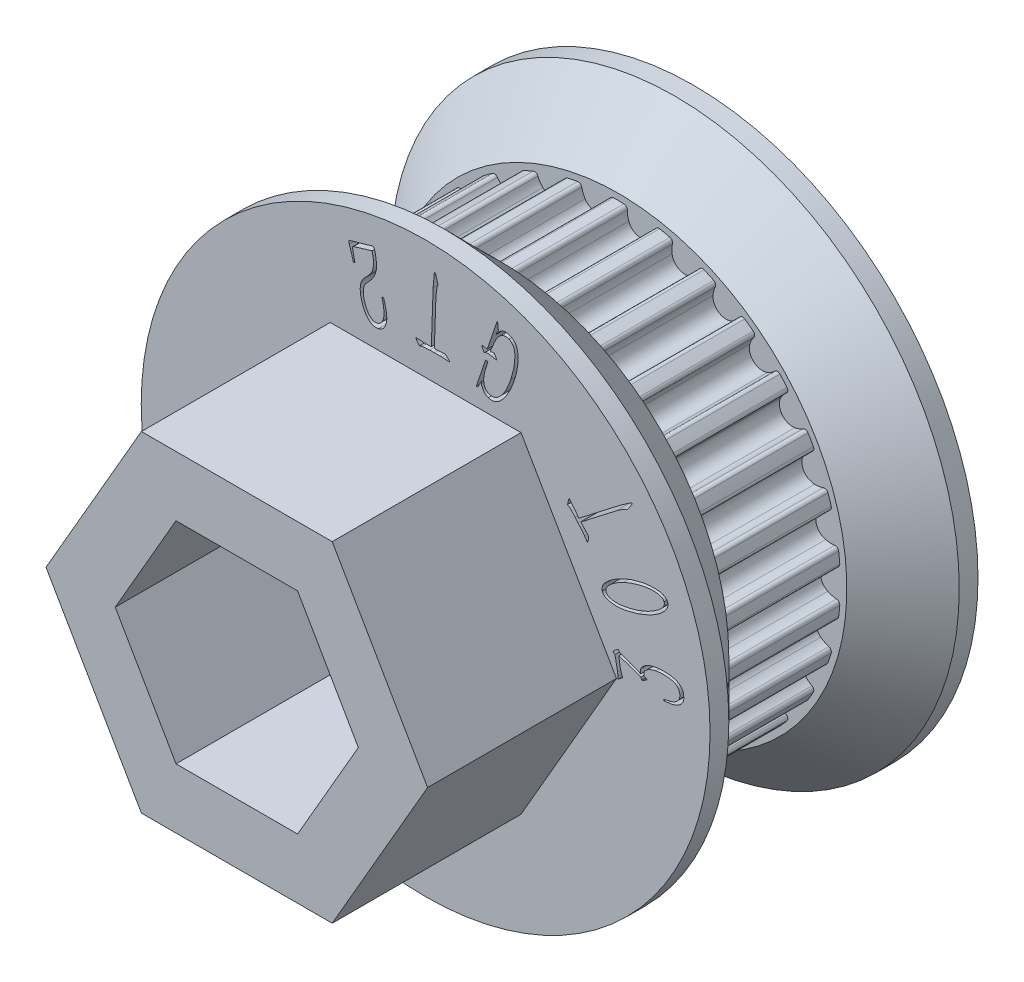
from build123d import *

# Parameters (mm, degrees)
SKETCH1_R           = 9.549296891
BASE_DEPTH          = 2.499999953
TOOTH_PROFILE_DEPTH = 15.400629892
TEETH_PATTERN_COUNT = 30
SKETCH3_R           = 12.049296844
FLANGE_DEPTH        = 3.175
FLANGE_CHAMFER_SIZE = 2.38125
ETCH_SIDE_1_DEPTH   = 1
ETCH_SIDE_2_DEPTH   = 1
CUT_EXTRUDE7_DEPTH  = 10
EXTRUDE_THIN1_DEPTH = 8


with BuildPart() as part:
    # Sketch1 → BASE (new, symmetric)
    with BuildSketch(Plane.XY):
        Circle(SKETCH1_R)
    extrude(amount=BASE_DEPTH, both=True)

    # Sketch2 → TOOTH PROFILE (cut, through all)
    with BuildSketch(Plane.XY.offset(2.499999953)):
        with BuildLine():
            Line((0, 9.399296891), (0, 9.549296891))
            ThreePointArc((0, 9.549296891), (0.998173329, 9.496984844), (1.985410463, 9.340621843))
            Line((1.985410463, 9.340621843), (1.954223709, 9.193899703))
            ThreePointArc((1.954223709, 9.193899703), (1.844512184, 9.21653714), (1.734538657, 9.237865429))
            ThreePointArc((1.734538657, 9.237865429), (1.621516613, 9.213798397), (1.559142482, 9.11652213))
            ThreePointArc((1.559142482, 9.11652213), (1.507840147, 8.931726865), (1.422203783, 8.760123739))
            ThreePointArc((1.422203783, 8.760123739), (0.893644866, 8.502462948), (0.43020692, 8.864386811))
            ThreePointArc((0.43020692, 8.864386811), (0.382120212, 9.050044798), (0.370360053, 9.241468198))
            ThreePointArc((0.370360053, 9.241468198), (0.329573819, 9.349587057), (0.224025395, 9.396626771))
            ThreePointArc((0.224025395, 9.396626771), (0.112020653, 9.398629337), (0, 9.399296891))
        make_face()
    tooth_profile = extrude(amount=-TOOTH_PROFILE_DEPTH, mode=Mode.SUBTRACT)

    # TEETH PATTERN: TOOTH PROFILE ×30 about axis
    teeth_pattern_axis = Axis((0, 0, 2.499999953), (0, 0, 1))
    for i in range(1, TEETH_PATTERN_COUNT):
        add(tooth_profile.rotate(teeth_pattern_axis, i * 360 / TEETH_PATTERN_COUNT), mode=Mode.SUBTRACT)

    # Sketch3 → FLANGE (add)
    with BuildSketch(Plane.XY.offset(2.499999953)):
        Circle(SKETCH3_R)
    flange = extrude(amount=FLANGE_DEPTH)

    # FLANGE MIRROR: FLANGE across plane
    add(flange.mirror(Plane.XY))

    # FLANGE CHAMFER
    flange_chamfer_edges = [part.edges().sort_by_distance(p)[0] for p in [
        (-12.049296844, 0, -2.499999953),
        (-12.049296844, 0, 2.499999953),
    ]]
    chamfer(flange_chamfer_edges, length=FLANGE_CHAMFER_SIZE)

    # Sketch5 → ETCH SIDE 1 (cut)
    # profile 1 of 6: a face of its own
    with BuildSketch(Plane.XY.offset(5.674999953)):
        with BuildLine():
            add(Edge.make_bspline(
                [(9.112946162, 0.565587045), (9.091331356, 0.574468351), (9.049767351, 0.591546582), (8.989213306, 0.614818993), (8.934065983, 0.637522223), (8.883004848, 0.657137241), (8.836671743, 0.67445414), (8.795070705, 0.690334391), (8.758041543, 0.703750121), (8.71674059, 0.718318564), (8.674158284, 0.733321515), (8.632359449, 0.74751706), (8.602973781, 0.757925792), (8.58706056, 0.762719893), (8.581186094, 0.764489665)],
                knots=[0, 0, 0, 0, 1.481351746, 2.848552582, 4.112199171, 5.261766909, 6.315902274, 7.247892122, 8.084548267, 8.812525798, 10.02423911, 10.946529652, 11.611104805, 12, 12, 12, 12], degree=3))
            Line((8.581186094, 0.764489665), (8.183380852, 0.882207543))
            add(Edge.make_bspline(
                [(8.183380852, 0.882207543), (8.18871159, 0.850657989), (8.20030182, 0.782062127), (8.212473273, 0.694224522), (8.221077933, 0.621127257), (8.230036486, 0.571294446), (8.235996664, 0.527513624), (8.241647207, 0.500839834), (8.24426941, 0.488461538)],
                knots=[0, 0, 0, 0, 1.445210534, 3.142214318, 4.005175959, 4.768815093, 5.428653755, 6, 6, 6, 6], degree=3))
            Line((8.24426941, 0.488461538), (8.276743307, 0.353153633))
            add(Edge.make_bspline(
                [(8.276743307, 0.353153633), (8.278753832, 0.347283508), (8.284185583, 0.331424436), (8.295387498, 0.30134017), (8.310697376, 0.258177229), (8.322722015, 0.225052827), (8.32951339, 0.206344556)],
                knots=[0, 0, 0, 0, 0.477263106, 1.289401791, 2.469086069, 4, 4, 4, 4], degree=3))
            Line((8.32951339, 0.206344556), (8.350486115, 0.162369486))
            Line((8.350486115, 0.162369486), (8.190822787, 0.035856595))
            add(Edge.make_bspline(
                [(8.190822787, 0.035856595), (8.184390238, 0.030660487), (8.173441921, 0.021816614), (8.158346128, 0.013172716), (8.147189344, 0.007344057), (8.135982796, 0.012071185), (8.136560861, 0.029669006), (8.145777905, 0.043680794), (8.152666627, 0.061786536), (8.154101148, 0.081626986), (8.152732045, 0.106003454), (8.148931141, 0.123621273), (8.146847718, 0.133278287)],
                knots=[0, 0, 0, 0, 1.329272548, 2.262446672, 2.874598649, 3.234258504, 4.008920684, 5.202894903, 6.057757619, 7.086111734, 8.402784258, 10, 10, 10, 10], degree=3))
            Line((8.146847718, 0.133278287), (8.131287309, 0.278734285))
            Line((8.131287309, 0.278734285), (8.021011366, 0.847704027))
            Line((8.021011366, 0.847704027), (7.977036296, 0.889649478))
            Line((7.977036296, 0.889649478), (7.937797004, 0.923476454))
            add(Edge.make_bspline(
                [(7.937797004, 0.923476454), (7.939137579, 0.924842822), (7.944283015, 0.930087259), (7.957033813, 0.94050867), (7.976156895, 0.960239145), (7.992483278, 0.975014234), (8.002068259, 0.983688472)],
                knots=[0, 0, 0, 0, 0.260695182, 1.000608345, 2.239101012, 4, 4, 4, 4], degree=3))
            Line((8.002068259, 0.983688472), (8.104902267, 1.077727466))
            add(Edge.make_bspline(
                [(8.104902267, 1.077727466), (8.112254384, 1.084241894), (8.124290174, 1.094906344), (8.144040095, 1.103637225), (8.158269038, 1.097484971), (8.170984133, 1.088349696), (8.186454478, 1.07304503), (8.19703628, 1.060463415), (8.203000498, 1.053372043)],
                knots=[0, 0, 0, 0, 1.447815425, 2.370147928, 2.857056092, 3.61108649, 4.653537471, 6, 6, 6, 6], degree=3))
            Line((8.203000498, 1.053372043), (8.247652107, 1.006014277))
            add(Edge.make_bspline(
                [(8.247652107, 1.006014277), (8.285317988, 0.9940784), (8.356841295, 0.9714135), (8.458809191, 0.938823829), (8.549780355, 0.909321552), (8.629854709, 0.882282393), (8.698707572, 0.857713217), (8.756935099, 0.837229541), (8.803883635, 0.818674486), (8.831514884, 0.807359079), (8.84368343, 0.802375879)],
                knots=[0, 0, 0, 0, 1.505108726, 2.858033639, 4.077778136, 5.148100622, 6.077293267, 6.862597673, 7.499098547, 8, 8, 8, 8], degree=3))
            Line((8.84368343, 0.802375879), (9.113622702, 0.684658001))
            add(Edge.make_bspline(
                [(9.113622702, 0.684658001), (9.111290212, 0.700686442), (9.106790602, 0.731606945), (9.09743746, 0.77831539), (9.099695486, 0.830479401), (9.118649895, 0.889231722), (9.15552163, 0.953666226), (9.203513505, 1.005279904), (9.251953896, 1.047566291), (9.299371421, 1.078493275), (9.353280725, 1.111423585), (9.414807329, 1.14230725), (9.480634345, 1.171655344), (9.54904146, 1.197842202), (9.619324013, 1.217849496), (9.714500161, 1.23815436), (9.833583035, 1.257221231), (9.929467307, 1.265680926), (9.976887138, 1.269864692)],
                knots=[0, 0, 0, 0, 0.656951525, 1.267326776, 1.926247984, 2.747761857, 3.746944023, 4.912547966, 5.586957614, 6.350337502, 7.203405728, 8.148048443, 9.138658829, 10.125379148, 11.115102931, 12.097960319, 14.070235528, 16, 16, 16, 16], degree=3))
            add(Edge.make_bspline(
                [(9.976887138, 1.269864692), (10.014543118, 1.271059066), (10.085564341, 1.27331172), (10.186241997, 1.272083725), (10.274756555, 1.266895503), (10.375179854, 1.255508334), (10.487301427, 1.233162203), (10.590900209, 1.199991073), (10.666454066, 1.168191439), (10.717557078, 1.141372642), (10.763164823, 1.109940441), (10.803316735, 1.075527018), (10.838702256, 1.04015306), (10.8669665, 1.003593943), (10.889496259, 0.967553369), (10.90842568, 0.919829704), (10.924282941, 0.861236748), (10.929574695, 0.813973713), (10.93216095, 0.790874707)],
                knots=[0, 0, 0, 0, 1.519536616, 2.865928616, 4.059778637, 5.094453099, 6.94084563, 8.661102098, 9.472112463, 10.245307543, 10.984583475, 11.700893487, 12.376298303, 12.998588676, 13.561758746, 14.08375336, 15.063466991, 16, 16, 16, 16], degree=3))
            add(Edge.make_bspline(
                [(10.93216095, 0.790874707), (10.933914743, 0.771271057), (10.937318109, 0.733228705), (10.935692844, 0.67794437), (10.929984241, 0.626628413), (10.918416797, 0.57869739), (10.899627273, 0.532673986), (10.871984671, 0.487511278), (10.834804461, 0.443243042), (10.790652354, 0.398798148), (10.739092128, 0.357239072), (10.680991694, 0.32074588), (10.617763736, 0.288509809), (10.526679038, 0.254588686), (10.40909252, 0.223439142), (10.313089305, 0.212441708), (10.265769516, 0.207021095)],
                knots=[0, 0, 0, 0, 0.82271502, 1.596540112, 2.309172736, 2.979590489, 3.652327459, 4.380404207, 5.18490551, 6.065465098, 6.998104514, 7.948140833, 8.931188859, 9.961406567, 12.009385563, 14, 14, 14, 14], degree=3))
            Line((10.265769516, 0.207021095), (10.087839621, 0.188754528))
            Line((10.087839621, 0.188754528), (10.084456923, 0.238818453))
            add(Edge.make_bspline(
                [(10.084456923, 0.238818453), (10.110399173, 0.244418141), (10.160299088, 0.255189139), (10.231828477, 0.271265216), (10.297164279, 0.287110717), (10.374586971, 0.305838065), (10.461484784, 0.332798724), (10.553519463, 0.375209363), (10.630636555, 0.427395603), (10.691453215, 0.488569167), (10.736201599, 0.555741158), (10.760508839, 0.627717732), (10.769339176, 0.699383714), (10.76601263, 0.746224518), (10.764379148, 0.769225442)],
                knots=[0, 0, 0, 0, 0.990350968, 1.904939946, 2.735660901, 3.498989238, 4.877541184, 6.123587096, 7.267341974, 8.332487761, 9.324517685, 10.250648159, 11.14099023, 12, 12, 12, 12], degree=3))
            add(Edge.make_bspline(
                [(10.764379148, 0.769225442), (10.761784693, 0.787839616), (10.756734264, 0.824074426), (10.739785328, 0.87566766), (10.717101448, 0.923392505), (10.686560034, 0.966226645), (10.651000921, 1.005501753), (10.607282645, 1.037782068), (10.558234349, 1.066100257), (10.483000643, 1.095053513), (10.380800577, 1.122200178), (10.251787134, 1.138374256), (10.120838885, 1.144340847), (9.991397131, 1.144216148), (9.864616676, 1.135129851), (9.782372721, 1.118935548), (9.741451383, 1.110877903)],
                knots=[0, 0, 0, 0, 0.653318615, 1.271766134, 1.882940202, 2.486446681, 3.097721661, 3.719749224, 4.370466379, 5.064660447, 6.520132082, 8.041797321, 9.583116473, 11.083185711, 12.548708599, 14, 14, 14, 14], degree=3))
            add(Edge.make_bspline(
                [(9.741451383, 1.110877903), (9.697398784, 1.100401907), (9.61023815, 1.079674538), (9.506758576, 1.039116416), (9.430006884, 1.001033438), (9.379431024, 0.967274296), (9.334613583, 0.930392317), (9.297273719, 0.890282204), (9.267659531, 0.849994956), (9.249836584, 0.810119491), (9.240229221, 0.771889023), (9.244715532, 0.747806525), (9.246900989, 0.736075005)],
                knots=[0, 0, 0, 0, 2.018767111, 3.994248438, 4.943957072, 5.837167628, 6.701799075, 7.527788456, 8.278894094, 8.918576059, 9.473196434, 10, 10, 10, 10], degree=3))
            Line((9.246900989, 0.736075005), (9.261784858, 0.663685276))
            Line((9.261784858, 0.663685276), (9.322673416, 0.635947155))
            add(Edge.make_bspline(
                [(9.322673416, 0.635947155), (9.330321884, 0.632372851), (9.343887135, 0.626033501), (9.361698996, 0.617403413), (9.37284313, 0.610904533), (9.38123001, 0.605325703), (9.379442738, 0.596395629), (9.370320984, 0.589167749), (9.356227968, 0.578900112), (9.343993898, 0.572192913), (9.336880746, 0.568293203)],
                knots=[0, 0, 0, 0, 1.636635816, 2.90272138, 3.761753699, 4.254518511, 4.605667467, 5.314686085, 6.438700335, 8, 8, 8, 8], degree=3))
            Line((9.336880746, 0.568293203), (9.200896301, 0.485078841))
            add(Edge.make_bspline(
                [(9.200896301, 0.485078841), (9.193307852, 0.479508318), (9.179809384, 0.469599373), (9.163420305, 0.471895722), (9.156244692, 0.472901129)],
                knots=[0, 0, 0, 0, 1.12434216, 2, 2, 2, 2], degree=3))
            Line((9.156244692, 0.472901129), (9.140007743, 0.508757724))
            Line((9.140007743, 0.508757724), (9.112946162, 0.565587045))
        make_face()
    # profile 2 of 6: a face of its own
    with BuildSketch(Plane.XY.offset(5.674999953)):
        with BuildLine():
            add(Edge.make_bspline(
                [(9.026020195, 2.840154307), (8.984628876, 2.826512093), (8.899630712, 2.798497447), (8.766907425, 2.761969489), (8.626693454, 2.726613988), (8.481218139, 2.694251423), (8.334856142, 2.668908891), (8.192175659, 2.654989538), (8.055856269, 2.65316106), (7.947267939, 2.6626102), (7.86580358, 2.674461243), (7.810583536, 2.684700172), (7.760339821, 2.695157648), (7.715719208, 2.707467892), (7.676057005, 2.720170898), (7.641525409, 2.734135304), (7.612283673, 2.74959765), (7.581072176, 2.771076224), (7.549705202, 2.799737044), (7.518498354, 2.835170952), (7.494942169, 2.871669048), (7.484926157, 2.897474301), (7.480127376, 2.909837878)],
                knots=[0, 0, 0, 0, 1.574977252, 3.234257292, 4.973912042, 6.801328025, 8.619705458, 10.339135779, 11.977544048, 13.539815222, 14.272941584, 14.952404458, 15.56950747, 16.127113552, 16.62458449, 17.074140885, 17.47161651, 17.817525167, 18.440947719, 19.001465292, 19.521591168, 20, 20, 20, 20], degree=3))
            add(Edge.make_bspline(
                [(7.480127376, 2.909837878), (7.477967099, 2.922427948), (7.473400938, 2.949039494), (7.473733083, 2.992438036), (7.481338368, 3.040088994), (7.492728073, 3.093151161), (7.515650721, 3.149370631), (7.549931277, 3.208110741), (7.597653812, 3.267596359), (7.677280246, 3.349491623), (7.790327764, 3.448725593), (7.913762957, 3.540360343), (8.019645319, 3.60946833), (8.105911162, 3.660635409), (8.197722067, 3.712509477), (8.329993268, 3.778572475), (8.500969937, 3.858521625), (8.64211932, 3.914308718), (8.712782394, 3.942237196)],
                knots=[0, 0, 0, 0, 0.35942079, 0.759705273, 1.215272011, 1.717698375, 2.2852106, 2.917270225, 3.627779994, 4.427693149, 6.13358171, 7.859269436, 8.754513143, 9.694885457, 10.684761896, 11.724755751, 13.859700874, 16, 16, 16, 16], degree=3))
            add(Edge.make_bspline(
                [(8.712782394, 3.942237196), (8.771070299, 3.960239574), (8.890823817, 3.997225774), (9.077320188, 4.046073956), (9.275198716, 4.087119509), (9.447335076, 4.106994289), (9.586768591, 4.116104769), (9.689271379, 4.118450657), (9.787957469, 4.114922479), (9.881702682, 4.107081708), (9.967863466, 4.094903499), (10.042606838, 4.074437049), (10.105826747, 4.049814558), (10.155016671, 4.016261316), (10.19411768, 3.980646533), (10.224766065, 3.944319418), (10.24750458, 3.907108574), (10.25639973, 3.881087936), (10.260704832, 3.868494388)],
                knots=[0, 0, 0, 0, 1.759601227, 3.615131473, 5.559422334, 7.583897157, 8.607287692, 9.589771067, 10.540091245, 11.454162684, 12.303362919, 13.045073106, 13.686588929, 14.249507383, 14.751422769, 15.20868991, 15.617019337, 16, 16, 16, 16], degree=3))
            add(Edge.make_bspline(
                [(10.260704832, 3.868494388), (10.263706954, 3.855933829), (10.270023134, 3.829507608), (10.269050289, 3.78582146), (10.260973632, 3.737629086), (10.247137277, 3.683799025), (10.222497004, 3.625648692), (10.183848163, 3.565157614), (10.133473247, 3.500709568), (10.070168056, 3.43431204), (9.997301162, 3.36715358), (9.916953196, 3.300481677), (9.829991543, 3.23557834), (9.736546826, 3.174490001), (9.641301192, 3.116130599), (9.545318232, 3.06340339), (9.451103619, 3.015075529), (9.357921139, 2.97354321), (9.267705504, 2.937057982), (9.182995569, 2.901571549), (9.102839483, 2.869776645), (9.051067076, 2.849812652), (9.026020195, 2.840154307)],
                knots=[0, 0, 0, 0, 0.452792773, 0.952632945, 1.522665432, 2.171215999, 2.903595011, 3.733671913, 4.689081475, 5.77797383, 6.956962985, 8.173942066, 9.44973348, 10.772233868, 12.100267804, 13.378720817, 14.624152104, 15.82446516, 16.966350752, 18.047818227, 19.055557477, 20, 20, 20, 20], degree=3))
        make_face()
        with BuildLine():
            add(Edge.make_bspline(
                [(8.992193219, 2.954489487), (9.012991953, 2.961563579), (9.057108013, 2.976568389), (9.126090517, 3.003458528), (9.202521682, 3.033942564), (9.315167723, 3.079567306), (9.458752603, 3.147799363), (9.59933172, 3.226678982), (9.707462684, 3.296361759), (9.78470442, 3.350746453), (9.857970961, 3.405756356), (9.924714075, 3.462595962), (9.983542532, 3.51830747), (10.032166646, 3.571252836), (10.068289465, 3.621525712), (10.092012382, 3.669061348), (10.105425611, 3.71294855), (10.112830182, 3.752209311), (10.112964006, 3.787682667), (10.106697175, 3.808590222), (10.103747662, 3.818430463)],
                knots=[0, 0, 0, 0, 0.796932065, 1.690367467, 2.685490482, 3.782454981, 6.099096655, 8.447363752, 9.625190013, 10.764626313, 11.874059648, 12.947835366, 13.943160157, 14.812174633, 15.552138674, 16.181477822, 16.730066847, 17.211596354, 17.628934046, 18, 18, 18, 18], degree=3))
            add(Edge.make_bspline(
                [(10.103747662, 3.818430463), (10.100211163, 3.827365032), (10.092663051, 3.84643449), (10.074090823, 3.87388835), (10.046369478, 3.899006015), (10.013572328, 3.926406544), (9.969497016, 3.950287006), (9.914225951, 3.969392139), (9.847386995, 3.983682203), (9.770942794, 3.994036294), (9.688231451, 4.000035133), (9.602615829, 4.000416191), (9.51584038, 3.996668691), (9.397852112, 3.983159061), (9.247283812, 3.958628531), (9.067721225, 3.917282801), (8.892958759, 3.870330748), (8.753087769, 3.825590295), (8.643554889, 3.786575913), (8.558339245, 3.751232776), (8.466919288, 3.713150864), (8.40465506, 3.684877308), (8.372483012, 3.670268307)],
                knots=[0, 0, 0, 0, 0.311891666, 0.665684658, 1.064872064, 1.523983675, 2.052326063, 2.683049578, 3.419370293, 4.27055838, 5.189308225, 6.113046001, 7.052447089, 8.01099039, 9.971884429, 12.008299114, 13.998303465, 15.853066346, 16.780665082, 17.777171755, 18.851460329, 20, 20, 20, 20], degree=3))
            add(Edge.make_bspline(
                [(8.372483012, 3.670268307), (8.342652489, 3.655509722), (8.284701836, 3.626838768), (8.201707788, 3.58321106), (8.125740288, 3.539764285), (8.033614679, 3.483233013), (7.926680052, 3.407003529), (7.826962137, 3.324956042), (7.755291795, 3.256496903), (7.712108935, 3.20588972), (7.678277925, 3.157453297), (7.655246656, 3.11036982), (7.640156573, 3.067031755), (7.631959625, 3.028204759), (7.628616032, 2.993715459), (7.63301067, 2.972945899), (7.635054928, 2.963284501)],
                knots=[0, 0, 0, 0, 1.300710092, 2.526841283, 3.663756903, 4.720392615, 6.75005905, 8.790318258, 9.762610591, 10.619160263, 11.386750363, 12.064707687, 12.66117179, 13.174557176, 13.616027894, 14, 14, 14, 14], degree=3))
            add(Edge.make_bspline(
                [(7.635054928, 2.963284501), (7.639465341, 2.95384837), (7.648796978, 2.933883225), (7.670450422, 2.90636505), (7.698323461, 2.879192693), (7.732350521, 2.850163489), (7.779985579, 2.824016407), (7.844081136, 2.80643655), (7.923489986, 2.789820882), (8.01884114, 2.779705503), (8.127842716, 2.776363742), (8.248241188, 2.782612256), (8.3785896, 2.800136244), (8.514609407, 2.827223113), (8.649485222, 2.858526851), (8.775509212, 2.889738497), (8.888440359, 2.921696239), (8.958866276, 2.943955814), (8.992193219, 2.954489487)],
                knots=[0, 0, 0, 0, 0.345967358, 0.732004277, 1.156856039, 1.642482697, 2.217309643, 2.948946442, 3.845958586, 4.919182407, 6.1364448, 7.475001785, 8.929169046, 10.512579223, 12.092155278, 13.540278261, 14.836010839, 16, 16, 16, 16], degree=3))
        make_face(mode=Mode.SUBTRACT)
    # profile 3 of 6: a face of its own
    with BuildSketch(Plane.XY.offset(5.674999953)):
        with BuildLine():
            Line((6.497417943, 5.088675977), (8.238830685, 6.434989635))
            Line((8.238830685, 6.434989635), (8.609574346, 6.693427734))
            add(Edge.make_bspline(
                [(8.609574346, 6.693427734), (8.627340832, 6.706546802), (8.658860036, 6.729821104), (8.698640967, 6.751564314), (8.725502872, 6.761193651), (8.736876732, 6.765013319), (8.747565284, 6.766259945), (8.748066022, 6.76158558), (8.748264949, 6.759728608)],
                knots=[0, 0, 0, 0, 2.451086645, 4.34842882, 5.071120089, 5.540028752, 5.817268476, 6, 6, 6, 6], degree=3))
            add(Edge.make_bspline(
                [(8.748264949, 6.759728608), (8.749026692, 6.757949834), (8.751039787, 6.753248978), (8.751519992, 6.742224976), (8.744916626, 6.72364178), (8.730189034, 6.700026356), (8.713401443, 6.67350516), (8.700991846, 6.656836326), (8.695494866, 6.649452665)],
                knots=[0, 0, 0, 0, 0.274568648, 0.72561651, 1.529012249, 3.03973807, 4.688716386, 6, 6, 6, 6], degree=3))
            Line((8.695494866, 6.649452665), (8.598749714, 6.506026286))
            add(Edge.make_bspline(
                [(8.598749714, 6.506026286), (8.590859153, 6.492795141), (8.577002608, 6.469560046), (8.556211769, 6.441125553), (8.54153212, 6.42154089), (8.525742443, 6.407898025), (8.502836478, 6.401813458), (8.47380342, 6.392616518), (8.43982109, 6.382312574), (8.405798855, 6.365980571), (8.370097185, 6.346214329), (8.3296491, 6.321565399), (8.279498717, 6.289542827), (8.217214141, 6.249461239), (8.144221618, 6.199396525), (8.093676872, 6.161421823), (8.066989646, 6.14137148)],
                knots=[0, 0, 0, 0, 0.985116831, 1.729954944, 2.25286518, 2.550366739, 3.043558942, 3.737445854, 4.513235005, 5.307461586, 6.147064848, 7.124648228, 8.337706315, 9.954809483, 11.864171342, 14, 14, 14, 14], degree=3))
            Line((8.066989646, 6.14137148), (6.579279226, 4.991254285))
            add(Edge.make_bspline(
                [(6.579279226, 4.991254285), (6.587136377, 4.98130458), (6.601739288, 4.962812553), (6.621176384, 4.939173718), (6.641301917, 4.917515551), (6.664489327, 4.892223805), (6.696749136, 4.857484947), (6.733712928, 4.816236273), (6.77073073, 4.776763076), (6.799519325, 4.744484501), (6.818938228, 4.724595268), (6.827592369, 4.714344836), (6.83027539, 4.71116692)],
                knots=[0, 0, 0, 0, 1.011065145, 1.879115365, 2.439198838, 3.368253309, 4.615462864, 6.219499481, 7.784864176, 8.930437553, 9.66840624, 10, 10, 10, 10], degree=3))
            Line((6.83027539, 4.71116692), (6.896576264, 4.647572205))
            Line((6.896576264, 4.647572205), (6.886428171, 4.443933807))
            add(Edge.make_bspline(
                [(6.886428171, 4.443933807), (6.884885205, 4.433846709), (6.882470003, 4.418057382), (6.875245984, 4.398482185), (6.863749989, 4.392642547), (6.852890269, 4.391539222), (6.840516292, 4.398770459), (6.834166803, 4.407057542), (6.83027539, 4.41213645)],
                knots=[0, 0, 0, 0, 1.875123891, 2.935129872, 3.538423906, 4.111924532, 4.842854508, 6, 6, 6, 6], degree=3))
            add(Edge.make_bspline(
                [(6.83027539, 4.41213645), (6.829219776, 4.414880099), (6.825641693, 4.424179898), (6.812599045, 4.441419693), (6.793021566, 4.468774699), (6.776692076, 4.489988943), (6.767357214, 4.502116207)],
                knots=[0, 0, 0, 0, 0.319667207, 1.083535338, 2.332783551, 4, 4, 4, 4], degree=3))
            Line((6.767357214, 4.502116207), (6.726088303, 4.561651685))
            add(Edge.make_bspline(
                [(6.726088303, 4.561651685), (6.725002515, 4.563930488), (6.72119575, 4.571919953), (6.709944433, 4.586893845), (6.69035112, 4.60893639), (6.675713342, 4.626971221), (6.667229364, 4.637424112)],
                knots=[0, 0, 0, 0, 0.314624313, 1.10307058, 2.320955245, 4, 4, 4, 4], degree=3))
            Line((6.667229364, 4.637424112), (6.609046965, 4.713196539))
            Line((6.609046965, 4.713196539), (6.456149032, 4.895862211))
            Line((6.456149032, 4.895862211), (6.335724996, 5.044700907))
            add(Edge.make_bspline(
                [(6.335724996, 5.044700907), (6.325108783, 5.057300563), (6.300404097, 5.08662086), (6.254423307, 5.129390933), (6.204736563, 5.179158278), (6.1627678, 5.220777579), (6.133649647, 5.252254476), (6.115652632, 5.268065928), (6.103450576, 5.279880013), (6.095188378, 5.28254575), (6.092170766, 5.28351936)],
                knots=[0, 0, 0, 0, 1.15473854, 2.687158992, 4.398539219, 6.087549424, 6.837044828, 7.396754698, 7.779676072, 8, 8, 8, 8], degree=3))
            Line((6.092170766, 5.28351936), (6.005573707, 5.337642522))
            Line((6.005573707, 5.337642522), (6.054284553, 5.542633999))
            add(Edge.make_bspline(
                [(6.054284553, 5.542633999), (6.057449062, 5.552815376), (6.062403688, 5.568756209), (6.070275857, 5.58759416), (6.078521305, 5.596133663), (6.086527356, 5.5984995), (6.093145977, 5.593577809), (6.101147826, 5.58618127), (6.11163019, 5.572852544), (6.119900427, 5.562677984), (6.124644664, 5.556841329)],
                knots=[0, 0, 0, 0, 2.085783773, 3.265681253, 3.919374746, 4.367804783, 4.722319855, 5.438135131, 6.530381495, 8, 8, 8, 8], degree=3))
            Line((6.124644664, 5.556841329), (6.182827063, 5.481068902))
            Line((6.182827063, 5.481068902), (6.395937014, 5.21248271))
            add(Edge.make_bspline(
                [(6.395937014, 5.21248271), (6.406059636, 5.198482707), (6.424110231, 5.173517989), (6.448301995, 5.140733598), (6.467168053, 5.117573836), (6.478212067, 5.10555657), (6.482534073, 5.100853688)],
                knots=[0, 0, 0, 0, 1.466387964, 2.614853807, 3.457931692, 4, 4, 4, 4], degree=3))
            Line((6.482534073, 5.100853688), (6.497417943, 5.088675977))
        make_face()
    # profile 4 of 6: a face of its own
    with BuildSketch(Plane.XY.offset(5.674999953)):
        with BuildLine():
            add(Edge.make_bspline(
                [(2.741382518, 9.337631829), (2.754234419, 9.338565097), (2.777005725, 9.340218684), (2.807259334, 9.342023271), (2.829115018, 9.344092192), (2.841059747, 9.345295849), (2.845569605, 9.345750303)],
                knots=[0, 0, 0, 0, 1.479566456, 2.621531176, 3.479544543, 4, 4, 4, 4], degree=3))
            Line((2.845569605, 9.345750303), (2.906458163, 9.353868778))
            Line((2.906458163, 9.353868778), (2.989672525, 9.200294305))
            add(Edge.make_bspline(
                [(2.989672525, 9.200294305), (2.99565294, 9.192163177), (3.00468278, 9.179885971), (3.009117864, 9.159178501), (3.000628209, 9.149846897), (2.994453632, 9.142293106), (2.984305427, 9.13852958), (2.977066666, 9.138230591), (2.972759036, 9.138052668)],
                knots=[0, 0, 0, 0, 2.082939268, 3.145034065, 3.872428009, 4.523028932, 5.121086553, 6, 6, 6, 6], degree=3))
            Line((2.972759036, 9.138052668), (2.869248489, 9.173232724))
            Line((2.869248489, 9.173232724), (2.771150257, 9.182704277))
            Line((2.771150257, 9.182704277), (2.652079301, 9.199617765))
            add(Edge.make_bspline(
                [(2.652079301, 9.199617765), (2.643522042, 9.201311785), (2.621388937, 9.205693319), (2.585396441, 9.201735254), (2.548661409, 9.200921), (2.52902731, 9.190195133), (2.521507172, 9.186086975)],
                knots=[0, 0, 0, 0, 0.778716672, 2.014128496, 3.239383113, 4, 4, 4, 4], degree=3))
            Line((2.521507172, 9.186086975), (2.4809148, 9.151583459))
            Line((2.4809148, 9.151583459), (2.390935043, 9.311923327))
            add(Edge.make_bspline(
                [(2.390935043, 9.311923327), (2.387921195, 9.31952379), (2.382080465, 9.334253216), (2.385846182, 9.35578678), (2.392111375, 9.373165476), (2.401045657, 9.377802252), (2.404465834, 9.37957728)],
                knots=[0, 0, 0, 0, 1.263937128, 2.449465059, 3.406431923, 4, 4, 4, 4], degree=3))
            Line((2.404465834, 9.37957728), (2.436263192, 9.374164963))
            Line((2.436263192, 9.374164963), (2.608780771, 9.344397224))
            Line((2.608780771, 9.344397224), (2.975465195, 10.420771612))
            add(Edge.make_bspline(
                [(2.975465195, 10.420771612), (2.97967168, 10.433205256), (2.987491201, 10.456318407), (2.999503527, 10.488048062), (3.008271132, 10.515396922), (3.017412595, 10.5363038), (3.023688085, 10.553146235), (3.030119185, 10.562322602), (3.031819434, 10.571393085), (3.042409992, 10.570751874), (3.043597679, 10.546513087), (3.051958754, 10.522979445), (3.057173561, 10.493419162), (3.058758537, 10.475544815), (3.059356096, 10.468805918)],
                knots=[0, 0, 0, 0, 1.754872244, 3.262167197, 4.540238825, 5.58188986, 6.338247766, 6.877729839, 7.188225089, 7.308856947, 8.132561453, 9.588288625, 11.090748618, 12, 12, 12, 12], degree=3))
            Line((3.059356096, 10.468805918), (3.062062254, 10.405211202))
            Line((3.062062254, 10.405211202), (3.075593045, 10.318614143))
            add(Edge.make_bspline(
                [(3.075593045, 10.318614143), (3.07819634, 10.305065483), (3.08280487, 10.28108072), (3.077779607, 10.257263957), (3.075593045, 10.246900953)],
                knots=[0, 0, 0, 0, 1.129772257, 2, 2, 2, 2], degree=3))
            Line((3.075593045, 10.246900953), (3.047854924, 10.207661661))
            Line((3.047854924, 10.207661661), (2.969376339, 10.060852583))
            add(Edge.make_bspline(
                [(2.969376339, 10.060852583), (2.978985361, 10.072018271), (3.002133306, 10.098916191), (3.037957377, 10.148648611), (3.087451021, 10.205802232), (3.13602963, 10.25666304), (3.181567357, 10.296104958), (3.222627912, 10.319755717), (3.267025407, 10.338881597), (3.315434644, 10.351392227), (3.365107516, 10.35875356), (3.415348134, 10.360401861), (3.464886472, 10.354823787), (3.497148241, 10.346926683), (3.513314119, 10.342969566)],
                knots=[0, 0, 0, 0, 0.800465401, 1.928305284, 3.328395462, 4.906066953, 5.75047444, 6.591404599, 7.470256156, 8.371228079, 9.30044429, 10.195643641, 11.095864718, 12, 12, 12, 12], degree=3))
            add(Edge.make_bspline(
                [(3.513314119, 10.342969566), (3.542434974, 10.334692707), (3.600313935, 10.31824209), (3.677878929, 10.272744368), (3.745646721, 10.217613385), (3.792886969, 10.163321454), (3.825336451, 10.115345529), (3.845171198, 10.073306616), (3.863628338, 10.026632772), (3.878854556, 9.974488881), (3.891900898, 9.916904011), (3.901713465, 9.853593575), (3.909137046, 9.784059716), (3.913756364, 9.709123129), (3.915260605, 9.629199333), (3.912098133, 9.545258179), (3.906477356, 9.457157454), (3.891544975, 9.337723302), (3.869447088, 9.193124217), (3.831523512, 9.027344242), (3.784904871, 8.864409627), (3.72950797, 8.696124299), (3.665543875, 8.518883142), (3.612243669, 8.401635234), (3.585027308, 8.341765645)],
                knots=[0, 0, 0, 0, 0.891820821, 1.772532473, 2.634728676, 3.466379118, 3.889830909, 4.343045633, 4.83704023, 5.37281844, 5.947001223, 6.581636328, 7.265622117, 8.0137927, 8.800621786, 9.627770414, 10.496566103, 11.409543076, 13.185204626, 14.818803847, 16.433353933, 18.193830659, 20.056478813, 22, 22, 22, 22], degree=3))
            add(Edge.make_bspline(
                [(3.585027308, 8.341765645), (3.560303832, 8.292320719), (3.50935259, 8.19042241), (3.421489619, 8.04089068), (3.32021708, 7.895616663), (3.223127098, 7.786217696), (3.142120277, 7.709225074), (3.082285054, 7.663146541), (3.024819361, 7.626129538), (2.968416454, 7.601478502), (2.916197168, 7.584780434), (2.869165518, 7.573089693), (2.827563578, 7.56577541), (2.778867828, 7.564039109), (2.720833436, 7.571539178), (2.675881321, 7.582474809), (2.65275584, 7.588100612)],
                knots=[0, 0, 0, 0, 1.780198602, 3.66871264, 5.581225383, 7.474677742, 8.368887012, 9.176673544, 9.904258847, 10.564320205, 11.152351024, 11.668520785, 12.124678813, 12.509919133, 13.23343237, 14, 14, 14, 14], degree=3))
            add(Edge.make_bspline(
                [(2.65275584, 7.588100612), (2.625808356, 7.599178685), (2.573598676, 7.620642011), (2.505277975, 7.671048166), (2.451736541, 7.737284815), (2.41770612, 7.800746848), (2.394800798, 7.852497064), (2.381627444, 7.887322878), (2.370094002, 7.916047216), (2.365312313, 7.933992083), (2.363196923, 7.941930785)],
                knots=[0, 0, 0, 0, 1.46233762, 2.833220978, 4.219378622, 5.712911178, 6.444586193, 7.066258055, 7.586918113, 8, 8, 8, 8], degree=3))
            Line((2.363196923, 7.941930785), (2.35237229, 8.023115528))
            Line((2.35237229, 8.023115528), (2.19609166, 7.73423315))
            Line((2.19609166, 7.73423315), (2.144674656, 7.751823178))
            Line((2.144674656, 7.751823178), (2.543156437, 8.922913099))
            Line((2.543156437, 8.922913099), (2.635165813, 8.896528057))
            add(Edge.make_bspline(
                [(2.635165813, 8.896528057), (2.628463742, 8.876210543), (2.613919962, 8.832120668), (2.589659311, 8.763309125), (2.566108752, 8.689282069), (2.546779043, 8.625487116), (2.532366763, 8.571218486), (2.52097838, 8.524729035), (2.508835502, 8.472122279), (2.491241358, 8.396868856), (2.472542335, 8.305186375), (2.458025534, 8.20104496), (2.457011792, 8.102293101), (2.467807622, 8.022419471), (2.482343682, 7.960299887), (2.498110398, 7.918206938), (2.516843011, 7.88035261), (2.547997765, 7.836877811), (2.597207474, 7.789687909), (2.645028554, 7.764252662), (2.669669328, 7.751146638)],
                knots=[0, 0, 0, 0, 0.923714475, 2.004499885, 3.149972049, 4.27750926, 4.882132738, 5.574062775, 6.344009558, 7.213206937, 8.910793216, 10.38298404, 11.746171584, 13.160423729, 13.852353765, 14.49623569, 15.097163054, 15.669899136, 16.799368573, 18, 18, 18, 18], degree=3))
            add(Edge.make_bspline(
                [(2.669669328, 7.751146638), (2.69004136, 7.744512772), (2.729749529, 7.731582364), (2.79086281, 7.721667933), (2.851168927, 7.722611384), (2.911018305, 7.732545255), (2.970523911, 7.754577748), (3.03020236, 7.787403758), (3.090041468, 7.832254173), (3.148962938, 7.887503568), (3.206799985, 7.94924417), (3.260975753, 8.015911707), (3.311137435, 8.085356611), (3.370441729, 8.181338709), (3.435815471, 8.300935993), (3.500249623, 8.445433585), (3.556103547, 8.587575343), (3.589382501, 8.682633124), (3.606000034, 8.730099334)],
                knots=[0, 0, 0, 0, 0.685852487, 1.336830163, 1.972715826, 2.610609835, 3.27114132, 3.995424059, 4.785915653, 5.660321415, 6.580489085, 7.49456569, 8.410952554, 9.3231424, 11.107901119, 12.77329818, 14.388776757, 16, 16, 16, 16], degree=3))
            add(Edge.make_bspline(
                [(3.606000034, 8.730099334), (3.626066201, 8.793047507), (3.667682383, 8.923598729), (3.709221044, 9.091388093), (3.738774828, 9.228584956), (3.756739777, 9.328249687), (3.768821943, 9.422661556), (3.776184238, 9.511407139), (3.780039162, 9.593094732), (3.781967648, 9.667345061), (3.779564558, 9.733228986), (3.776100162, 9.792029505), (3.768391272, 9.844648594), (3.758439354, 9.892604522), (3.745815941, 9.936497225), (3.724350825, 9.987263535), (3.69402916, 10.042923401), (3.648612236, 10.098398916), (3.595232414, 10.143096512), (3.553541602, 10.162550021), (3.532257225, 10.172481605)],
                knots=[0, 0, 0, 0, 2.290021657, 4.749385289, 5.988364485, 7.155476093, 8.25903199, 9.286818871, 10.241790525, 11.094116379, 11.860657647, 12.526857124, 13.13496938, 13.70231342, 14.224261599, 14.715004674, 15.611065805, 16.410893494, 17.188714726, 18, 18, 18, 18], degree=3))
            add(Edge.make_bspline(
                [(3.532257225, 10.172481605), (3.512419862, 10.180128146), (3.472148047, 10.195651381), (3.406768359, 10.202663822), (3.339444831, 10.199150479), (3.271475832, 10.180191248), (3.203940658, 10.146064764), (3.139049375, 10.096236485), (3.077892984, 10.033491147), (3.023796781, 9.959718775), (2.976774039, 9.878888466), (2.933227611, 9.796456101), (2.895788605, 9.714145027), (2.859217882, 9.634403514), (2.824348823, 9.55210931), (2.802335621, 9.495329738), (2.790769904, 9.4654978)],
                knots=[0, 0, 0, 0, 0.774451651, 1.57221361, 2.381819978, 3.227974314, 4.131450024, 5.1324975, 6.205408945, 7.325206223, 8.46784414, 9.622292505, 10.732668923, 11.773378748, 12.8301351, 14, 14, 14, 14], degree=3))
            Line((2.790769904, 9.4654978), (2.741382518, 9.337631829))
        make_face()
    # profile 5 of 6: a face of its own
    with BuildSketch(Plane.XY.offset(5.674999953)):
        with BuildLine():
            Line((0.240010644, 8.249190781), (0.316459611, 10.447944243))
            Line((0.316459611, 10.447944243), (0.355698903, 10.899196108))
            add(Edge.make_bspline(
                [(0.355698903, 10.899196108), (0.356835518, 10.921113245), (0.358854581, 10.960046468), (0.3660915, 11.005000621), (0.376927073, 11.031442833), (0.380801276, 11.043250317), (0.387113767, 11.051336483), (0.390841495, 11.049424546), (0.392232038, 11.048711343)],
                knots=[0, 0, 0, 0, 2.44965833, 4.351530748, 5.076773046, 5.572933016, 5.840692635, 6, 6, 6, 6], degree=3))
            add(Edge.make_bspline(
                [(0.392232038, 11.048711343), (0.394327859, 11.048165097), (0.39956353, 11.046800495), (0.407911298, 11.038854247), (0.419271724, 11.022745708), (0.427599237, 10.995616181), (0.437337568, 10.96627355), (0.44174354, 10.946367751), (0.443649042, 10.937758861)],
                knots=[0, 0, 0, 0, 0.304435711, 0.760525158, 1.588679827, 3.102378211, 4.746832101, 6, 6, 6, 6], degree=3))
            Line((0.443649042, 10.937758861), (0.492359888, 10.771330137))
            add(Edge.make_bspline(
                [(0.492359888, 10.771330137), (0.497173975, 10.75670344), (0.505647393, 10.73095856), (0.515680653, 10.697228709), (0.520207363, 10.673230939), (0.521083654, 10.652545912), (0.511113985, 10.631102724), (0.499895062, 10.602852274), (0.487024064, 10.569760024), (0.476674789, 10.53335489), (0.469663666, 10.493108522), (0.461423984, 10.446338239), (0.455579133, 10.386969501), (0.445092375, 10.313511634), (0.437231142, 10.225496586), (0.434786938, 10.162460051), (0.433500949, 10.129294126)],
                knots=[0, 0, 0, 0, 0.986137351, 1.735729423, 2.248381339, 2.551550021, 3.040053639, 3.726361954, 4.512063428, 5.307256943, 6.145326358, 7.125528176, 8.346765888, 9.961924463, 11.875414487, 14, 14, 14, 14], degree=3))
            Line((0.433500949, 10.129294126), (0.367876615, 8.249190781))
            add(Edge.make_bspline(
                [(0.367876615, 8.249190781), (0.380728733, 8.24887651), (0.40440437, 8.248297575), (0.435336542, 8.248721365), (0.46459722, 8.251022502), (0.498928736, 8.251760979), (0.545781037, 8.255103051), (0.601054315, 8.257370552), (0.654771087, 8.259194014), (0.697757442, 8.263073628), (0.725331203, 8.262995785), (0.738621378, 8.263822281), (0.742679513, 8.26407465)],
                knots=[0, 0, 0, 0, 1.02795302, 1.89365229, 2.471785802, 3.374081213, 4.638344491, 6.226753886, 7.797150604, 8.935421808, 9.674932713, 10, 10, 10, 10], degree=3))
            Line((0.742679513, 8.26407465), (0.834688888, 8.274222743))
            Line((0.834688888, 8.274222743), (0.984880663, 8.13620868))
            add(Edge.make_bspline(
                [(0.984880663, 8.13620868), (0.992075599, 8.12861418), (1.003062598, 8.117017028), (1.012751008, 8.098491704), (1.009780031, 8.086194014), (1.004274852, 8.076498616), (0.990365736, 8.072962038), (0.98030799, 8.072747391), (0.974056031, 8.072613964)],
                knots=[0, 0, 0, 0, 1.920051088, 2.932006865, 3.558771589, 4.149691037, 4.849836119, 6, 6, 6, 6], degree=3))
            add(Edge.make_bspline(
                [(0.974056031, 8.072613964), (0.971143949, 8.07361189), (0.961563744, 8.076894881), (0.93991123, 8.077255414), (0.906468994, 8.079902952), (0.879812582, 8.08085851), (0.864456628, 8.081408978)],
                knots=[0, 0, 0, 0, 0.333978483, 1.098726731, 2.328663978, 4, 4, 4, 4], degree=3))
            Line((0.864456628, 8.081408978), (0.792066898, 8.088850913))
            add(Edge.make_bspline(
                [(0.792066898, 8.088850913), (0.789600134, 8.089618227), (0.781071721, 8.092271085), (0.762196895, 8.091011665), (0.733031904, 8.092746741), (0.709997265, 8.092421638), (0.696674825, 8.09223361)],
                knots=[0, 0, 0, 0, 0.322467791, 1.114876966, 2.331344523, 4, 4, 4, 4], degree=3))
            Line((0.696674825, 8.09223361), (0.600606212, 8.095616308))
            Line((0.600606212, 8.095616308), (0.362464299, 8.094263229))
            Line((0.362464299, 8.094263229), (0.171003612, 8.096292847))
            add(Edge.make_bspline(
                [(0.171003612, 8.096292847), (0.154527185, 8.096079296), (0.116071635, 8.095580873), (0.053719787, 8.088437859), (-0.016137872, 8.081462349), (-0.074679596, 8.075484449), (-0.117375545, 8.074216115), (-0.141077229, 8.070130685), (-0.15790007, 8.067976355), (-0.165731699, 8.063950287), (-0.16861923, 8.062465871)],
                knots=[0, 0, 0, 0, 1.15532886, 2.69650734, 4.398221096, 6.081226413, 6.826302459, 7.385641117, 7.773485107, 8, 8, 8, 8], degree=3))
            Line((-0.16861923, 8.062465871), (-0.265364383, 8.029315434))
            Line((-0.265364383, 8.029315434), (-0.391877274, 8.198450316))
            add(Edge.make_bspline(
                [(-0.391877274, 8.198450316), (-0.397723884, 8.207246037), (-0.406907892, 8.221062588), (-0.415989666, 8.239468252), (-0.416162225, 8.250811876), (-0.413827897, 8.258670181), (-0.405555492, 8.260492669), (-0.394968085, 8.261795769), (-0.378286543, 8.261311391), (-0.365471162, 8.260919108), (-0.358050298, 8.260691952)],
                knots=[0, 0, 0, 0, 2.100778888, 3.299958786, 3.923468713, 4.362101613, 4.742620981, 5.46074923, 6.52962339, 8, 8, 8, 8], degree=3))
            Line((-0.358050298, 8.260691952), (-0.261981685, 8.257309255))
            Line((-0.261981685, 8.257309255), (0.080347316, 8.25054386))
            add(Edge.make_bspline(
                [(0.080347316, 8.25054386), (0.097483401, 8.24935097), (0.128135656, 8.247217184), (0.168952127, 8.245212626), (0.198973904, 8.244071987), (0.215430455, 8.244837754), (0.221744077, 8.245131543)],
                knots=[0, 0, 0, 0, 1.455821616, 2.604107886, 3.464460438, 4, 4, 4, 4], degree=3))
            Line((0.221744077, 8.245131543), (0.240010644, 8.249190781))
        make_face()
    # profile 6 of 6: a face of its own
    with BuildSketch(Plane.XY.offset(5.674999953)):
        with BuildLine():
            Line((-1.85161457, 9.02426472), (-1.785313696, 9.041854748))
            add(Edge.make_bspline(
                [(-1.785313696, 9.041854748), (-1.778147808, 9.021163241), (-1.764420914, 8.981526827), (-1.747581732, 8.924091707), (-1.731275285, 8.872790055), (-1.715211292, 8.809680712), (-1.694747705, 8.730363339), (-1.683155966, 8.665345866), (-1.677067372, 8.631195255)],
                knots=[0, 0, 0, 0, 0.926874431, 1.775510044, 2.533603534, 3.20517938, 4.532012598, 6, 6, 6, 6], degree=3))
            add(Edge.make_bspline(
                [(-1.677067372, 8.631195255), (-1.67210241, 8.60575252), (-1.662512831, 8.556611134), (-1.652311003, 8.484589335), (-1.646148301, 8.417299378), (-1.643814796, 8.353363807), (-1.64628953, 8.289687493), (-1.656193314, 8.223646403), (-1.672191401, 8.153451908), (-1.692717411, 8.081433659), (-1.719036021, 8.012540049), (-1.752341737, 7.952538127), (-1.791317288, 7.903358845), (-1.8368131, 7.867716104), (-1.882514395, 7.841791137), (-1.923968336, 7.818781433), (-1.962873958, 7.802369535), (-1.987988507, 7.794586397), (-1.999776726, 7.790933162)],
                knots=[0, 0, 0, 0, 1.244715635, 2.404106816, 3.491459782, 4.488327057, 5.474786606, 6.546877911, 7.689815044, 8.930472378, 10.141130781, 11.222480858, 12.215339899, 13.132039059, 13.977107189, 14.737738666, 15.407522183, 16, 16, 16, 16], degree=3))
            add(Edge.make_bspline(
                [(-1.999776726, 7.790933162), (-2.031074621, 7.786566668), (-2.093544097, 7.7778513), (-2.188220891, 7.790514887), (-2.277551352, 7.822145683), (-2.346664831, 7.861627246), (-2.398385482, 7.90102018), (-2.435135091, 7.937665863), (-2.472717427, 7.977893087), (-2.520280532, 8.039785344), (-2.574031465, 8.12427382), (-2.628706044, 8.233742772), (-2.672907298, 8.350994352), (-2.713148427, 8.471975889), (-2.746125905, 8.593295419), (-2.759283068, 8.674584701), (-2.765619471, 8.713733077)],
                knots=[0, 0, 0, 0, 0.991188244, 1.978376201, 2.970835037, 3.959783075, 4.471022813, 5.01331511, 5.591202429, 6.203316396, 7.46773078, 8.737793628, 10.048349105, 11.408932644, 12.752159212, 14, 14, 14, 14], degree=3))
            add(Edge.make_bspline(
                [(-2.765619471, 8.713733077), (-2.769010774, 8.755199592), (-2.775808915, 8.838322573), (-2.770614597, 8.942037431), (-2.761170359, 9.022105383), (-2.750490566, 9.077120517), (-2.736301543, 9.126651761), (-2.713140381, 9.187162382), (-2.672847942, 9.260004129), (-2.630727824, 9.312192268), (-2.6086623, 9.33953214)],
                knots=[0, 0, 0, 0, 1.498043104, 3.002948518, 3.731757689, 4.402766838, 5.020100134, 5.586082193, 6.735417617, 8, 8, 8, 8], degree=3))
            Line((-2.6086623, 9.33953214), (-2.428026247, 9.533698984))
            add(Edge.make_bspline(
                [(-2.428026247, 9.533698984), (-2.405435785, 9.559462902), (-2.362663361, 9.608243897), (-2.308590487, 9.684716739), (-2.266363573, 9.761397315), (-2.239335587, 9.8409243), (-2.222424782, 9.919223578), (-2.211575329, 9.997263454), (-2.207600139, 10.080100177), (-2.210128169, 10.153659774), (-2.212823255, 10.214645164), (-2.218030944, 10.256527711), (-2.222847865, 10.293242989), (-2.22806224, 10.315582623), (-2.230476705, 10.32592677)],
                knots=[0, 0, 0, 0, 1.4464878, 2.738757121, 3.949050613, 5.129974908, 6.27163794, 7.329133585, 8.454587802, 9.769409332, 10.437277986, 11.031607538, 11.55159546, 12, 12, 12, 12], degree=3))
            Line((-2.230476705, 10.32592677), (-2.270392537, 10.514681298))
            Line((-2.270392537, 10.514681298), (-3.053825309, 10.279922082))
            add(Edge.make_bspline(
                [(-3.053825309, 10.279922082), (-3.063949838, 10.276920009), (-3.081995766, 10.271569125), (-3.094791554, 10.24831969), (-3.092700156, 10.224341455), (-3.090149294, 10.19489313), (-3.085306487, 10.153318274), (-3.080753399, 10.121819696), (-3.078180732, 10.104021805)],
                knots=[0, 0, 0, 0, 0.928887784, 1.655646734, 2.190098764, 3.098285781, 4.360421499, 6, 6, 6, 6], degree=3))
            Line((-3.078180732, 10.104021805), (-2.99564291, 9.715688117))
            Line((-2.99564291, 9.715688117), (-3.057208007, 9.699451168))
            Line((-3.057208007, 9.699451168), (-3.232431744, 10.275862845))
            add(Edge.make_bspline(
                [(-3.232431744, 10.275862845), (-3.235726578, 10.28693564), (-3.241583603, 10.30661907), (-3.250251011, 10.331842385), (-3.254609095, 10.35004917), (-3.259125725, 10.364279988), (-3.258063116, 10.378693553), (-3.257061053, 10.394775167), (-3.242632812, 10.408515277), (-3.217888522, 10.41752957), (-3.181246354, 10.430621658), (-3.151783779, 10.438489031), (-3.135010052, 10.442968108)],
                knots=[0, 0, 0, 0, 1.365741549, 2.427795087, 3.145407866, 3.584955162, 4.171287493, 4.850769309, 5.397611745, 6.399083048, 7.949914634, 10, 10, 10, 10], degree=3))
            Line((-3.135010052, 10.442968108), (-2.261597523, 10.695993891))
            add(Edge.make_bspline(
                [(-2.261597523, 10.695993891), (-2.250873572, 10.698871983), (-2.229817356, 10.704523046), (-2.203585237, 10.688490425), (-2.187391966, 10.665783939), (-2.174822479, 10.636948541), (-2.160331225, 10.598045778), (-2.141963925, 10.529510924), (-2.118627237, 10.43107396), (-2.105017004, 10.348359122), (-2.097874958, 10.304954045)],
                knots=[0, 0, 0, 0, 0.55726778, 1.094181644, 1.463494324, 2.01061659, 2.725061825, 3.629765899, 5.706695003, 8, 8, 8, 8], degree=3))
            add(Edge.make_bspline(
                [(-2.097874958, 10.304954045), (-2.094690391, 10.279495054), (-2.088529667, 10.230243193), (-2.083712142, 10.15841365), (-2.079567739, 10.091440165), (-2.080105575, 10.02913827), (-2.081494605, 9.971294655), (-2.087018681, 9.918210029), (-2.094891774, 9.869779715), (-2.109272134, 9.813376124), (-2.130686735, 9.75074154), (-2.154848828, 9.682062628), (-2.181138081, 9.623029632), (-2.217878225, 9.55636971), (-2.270065792, 9.479599139), (-2.315805879, 9.421562295), (-2.339399569, 9.391625683)],
                knots=[0, 0, 0, 0, 1.10030787, 2.128607946, 3.087498468, 3.977454341, 4.800208144, 5.568317741, 6.264872119, 6.903025522, 8.062425963, 9.10293852, 10.025218088, 10.830440634, 12.365075281, 14, 14, 14, 14], degree=3))
            Line((-2.339399569, 9.391625683), (-2.490267883, 9.229932736))
            add(Edge.make_bspline(
                [(-2.490267883, 9.229932736), (-2.502400452, 9.216562015), (-2.525778442, 9.190798255), (-2.55672174, 9.150909202), (-2.580755417, 9.110872909), (-2.601311351, 9.070616819), (-2.615707511, 9.025452104), (-2.62543585, 8.972507669), (-2.631811987, 8.910525928), (-2.636317168, 8.816359729), (-2.630927753, 8.69441858), (-2.605396659, 8.549460691), (-2.561503736, 8.406997521), (-2.519331216, 8.315933933), (-2.497709818, 8.269246608)],
                knots=[0, 0, 0, 0, 0.636456153, 1.226373894, 1.775852736, 2.280731919, 2.816229784, 3.439895828, 4.175614339, 5.01132221, 6.762153191, 8.465222735, 10.187757618, 12, 12, 12, 12], degree=3))
            add(Edge.make_bspline(
                [(-2.497709818, 8.269246608), (-2.485077488, 8.245751485), (-2.460380679, 8.199817397), (-2.416704671, 8.137043973), (-2.370330125, 8.080493097), (-2.322046508, 8.02968153), (-2.26669097, 7.989142491), (-2.202135217, 7.96588999), (-2.130399814, 7.958323762), (-2.081576608, 7.965676935), (-2.055929507, 7.969539597)],
                knots=[0, 0, 0, 0, 1.102566264, 2.155569705, 3.156385435, 4.125940001, 5.049774921, 5.964619684, 6.93080344, 8, 8, 8, 8], degree=3))
            add(Edge.make_bspline(
                [(-2.055929507, 7.969539597), (-2.042676979, 7.972655316), (-2.016317327, 7.978852567), (-1.979884828, 7.99690083), (-1.944427926, 8.017595184), (-1.901488713, 8.054400229), (-1.853904028, 8.109780316), (-1.811422913, 8.189514119), (-1.780720375, 8.27873471), (-1.766017804, 8.378316835), (-1.763498138, 8.487406331), (-1.770816237, 8.607688364), (-1.78734899, 8.739645842), (-1.806911552, 8.830228025), (-1.817111054, 8.877455643)],
                knots=[0, 0, 0, 0, 0.470655213, 0.936146495, 1.403016041, 1.89178486, 2.890440468, 3.916179895, 5.007110753, 6.147836599, 7.392237567, 8.786847853, 10.324730999, 12, 12, 12, 12], degree=3))
            Line((-1.817111054, 8.877455643), (-1.85161457, 9.02426472))
        make_face()
    extrude(amount=-ETCH_SIDE_1_DEPTH, mode=Mode.SUBTRACT)

    # Sketch6 → ETCH SIDE 2 (cut)
    # profile 1 of 6: a face of its own
    with BuildSketch(Plane(origin=(0, 0, -5.674999953), x_dir=(-1, 0, 0), z_dir=(0, 0, -1))):
        with BuildLine():
            add(Edge.make_bspline(
                [(9.112946162, 0.565587045), (9.091331356, 0.574468351), (9.049767351, 0.591546582), (8.989213306, 0.614818993), (8.934065983, 0.637522223), (8.883004848, 0.657137241), (8.836671743, 0.67445414), (8.795070705, 0.690334391), (8.758041543, 0.703750121), (8.71674059, 0.718318564), (8.674158284, 0.733321515), (8.632359449, 0.74751706), (8.602973781, 0.757925792), (8.58706056, 0.762719893), (8.581186094, 0.764489665)],
                knots=[0, 0, 0, 0, 1.481351746, 2.848552582, 4.112199171, 5.261766909, 6.315902274, 7.247892122, 8.084548267, 8.812525798, 10.02423911, 10.946529652, 11.611104805, 12, 12, 12, 12], degree=3))
            Line((8.581186094, 0.764489665), (8.183380852, 0.882207543))
            add(Edge.make_bspline(
                [(8.183380852, 0.882207543), (8.18871159, 0.850657989), (8.20030182, 0.782062127), (8.212473273, 0.694224522), (8.221077933, 0.621127257), (8.230036486, 0.571294446), (8.235996664, 0.527513624), (8.241647207, 0.500839834), (8.24426941, 0.488461538)],
                knots=[0, 0, 0, 0, 1.445210534, 3.142214318, 4.005175959, 4.768815093, 5.428653755, 6, 6, 6, 6], degree=3))
            Line((8.24426941, 0.488461538), (8.276743307, 0.353153633))
            add(Edge.make_bspline(
                [(8.276743307, 0.353153633), (8.278753832, 0.347283508), (8.284185583, 0.331424436), (8.295387498, 0.30134017), (8.310697376, 0.258177229), (8.322722015, 0.225052827), (8.32951339, 0.206344556)],
                knots=[0, 0, 0, 0, 0.477263106, 1.289401791, 2.469086069, 4, 4, 4, 4], degree=3))
            Line((8.32951339, 0.206344556), (8.350486115, 0.162369486))
            Line((8.350486115, 0.162369486), (8.190822787, 0.035856595))
            add(Edge.make_bspline(
                [(8.190822787, 0.035856595), (8.184390238, 0.030660487), (8.173441921, 0.021816614), (8.158346128, 0.013172716), (8.147189344, 0.007344057), (8.135982796, 0.012071185), (8.136560861, 0.029669006), (8.145777905, 0.043680794), (8.152666627, 0.061786536), (8.154101148, 0.081626986), (8.152732045, 0.106003454), (8.148931141, 0.123621273), (8.146847718, 0.133278287)],
                knots=[0, 0, 0, 0, 1.329272548, 2.262446672, 2.874598649, 3.234258504, 4.008920684, 5.202894903, 6.057757619, 7.086111734, 8.402784258, 10, 10, 10, 10], degree=3))
            Line((8.146847718, 0.133278287), (8.131287309, 0.278734285))
            Line((8.131287309, 0.278734285), (8.021011366, 0.847704027))
            Line((8.021011366, 0.847704027), (7.977036296, 0.889649478))
            Line((7.977036296, 0.889649478), (7.937797004, 0.923476454))
            add(Edge.make_bspline(
                [(7.937797004, 0.923476454), (7.939137579, 0.924842822), (7.944283015, 0.930087259), (7.957033813, 0.94050867), (7.976156895, 0.960239145), (7.992483278, 0.975014234), (8.002068259, 0.983688472)],
                knots=[0, 0, 0, 0, 0.260695182, 1.000608345, 2.239101012, 4, 4, 4, 4], degree=3))
            Line((8.002068259, 0.983688472), (8.104902267, 1.077727466))
            add(Edge.make_bspline(
                [(8.104902267, 1.077727466), (8.112254384, 1.084241894), (8.124290174, 1.094906344), (8.144040095, 1.103637225), (8.158269038, 1.097484971), (8.170984133, 1.088349696), (8.186454478, 1.07304503), (8.19703628, 1.060463415), (8.203000498, 1.053372043)],
                knots=[0, 0, 0, 0, 1.447815425, 2.370147928, 2.857056092, 3.61108649, 4.653537471, 6, 6, 6, 6], degree=3))
            Line((8.203000498, 1.053372043), (8.247652107, 1.006014277))
            add(Edge.make_bspline(
                [(8.247652107, 1.006014277), (8.285317988, 0.9940784), (8.356841295, 0.9714135), (8.458809191, 0.938823829), (8.549780355, 0.909321552), (8.629854709, 0.882282393), (8.698707572, 0.857713217), (8.756935099, 0.837229541), (8.803883635, 0.818674486), (8.831514884, 0.807359079), (8.84368343, 0.802375879)],
                knots=[0, 0, 0, 0, 1.505108726, 2.858033639, 4.077778136, 5.148100622, 6.077293267, 6.862597673, 7.499098547, 8, 8, 8, 8], degree=3))
            Line((8.84368343, 0.802375879), (9.113622702, 0.684658001))
            add(Edge.make_bspline(
                [(9.113622702, 0.684658001), (9.111290212, 0.700686442), (9.106790602, 0.731606945), (9.09743746, 0.77831539), (9.099695486, 0.830479401), (9.118649895, 0.889231722), (9.15552163, 0.953666226), (9.203513505, 1.005279904), (9.251953896, 1.047566291), (9.299371421, 1.078493275), (9.353280725, 1.111423585), (9.414807329, 1.14230725), (9.480634345, 1.171655344), (9.54904146, 1.197842202), (9.619324013, 1.217849496), (9.714500161, 1.23815436), (9.833583035, 1.257221231), (9.929467307, 1.265680926), (9.976887138, 1.269864692)],
                knots=[0, 0, 0, 0, 0.656951525, 1.267326776, 1.926247984, 2.747761857, 3.746944023, 4.912547966, 5.586957614, 6.350337502, 7.203405728, 8.148048443, 9.138658829, 10.125379148, 11.115102931, 12.097960319, 14.070235528, 16, 16, 16, 16], degree=3))
            add(Edge.make_bspline(
                [(9.976887138, 1.269864692), (10.014543118, 1.271059066), (10.085564341, 1.27331172), (10.186241997, 1.272083725), (10.274756555, 1.266895503), (10.375179854, 1.255508334), (10.487301427, 1.233162203), (10.590900209, 1.199991073), (10.666454066, 1.168191439), (10.717557078, 1.141372642), (10.763164823, 1.109940441), (10.803316735, 1.075527018), (10.838702256, 1.04015306), (10.8669665, 1.003593943), (10.889496259, 0.967553369), (10.90842568, 0.919829704), (10.924282941, 0.861236748), (10.929574695, 0.813973713), (10.93216095, 0.790874707)],
                knots=[0, 0, 0, 0, 1.519536616, 2.865928616, 4.059778637, 5.094453099, 6.94084563, 8.661102098, 9.472112463, 10.245307543, 10.984583475, 11.700893487, 12.376298303, 12.998588676, 13.561758746, 14.08375336, 15.063466991, 16, 16, 16, 16], degree=3))
            add(Edge.make_bspline(
                [(10.93216095, 0.790874707), (10.933914743, 0.771271057), (10.937318109, 0.733228705), (10.935692844, 0.67794437), (10.929984241, 0.626628413), (10.918416797, 0.57869739), (10.899627273, 0.532673986), (10.871984671, 0.487511278), (10.834804461, 0.443243042), (10.790652354, 0.398798148), (10.739092128, 0.357239072), (10.680991694, 0.32074588), (10.617763736, 0.288509809), (10.526679038, 0.254588686), (10.40909252, 0.223439142), (10.313089305, 0.212441708), (10.265769516, 0.207021095)],
                knots=[0, 0, 0, 0, 0.82271502, 1.596540112, 2.309172736, 2.979590489, 3.652327459, 4.380404207, 5.18490551, 6.065465098, 6.998104514, 7.948140833, 8.931188859, 9.961406567, 12.009385563, 14, 14, 14, 14], degree=3))
            Line((10.265769516, 0.207021095), (10.087839621, 0.188754528))
            Line((10.087839621, 0.188754528), (10.084456923, 0.238818453))
            add(Edge.make_bspline(
                [(10.084456923, 0.238818453), (10.110399173, 0.244418141), (10.160299088, 0.255189139), (10.231828477, 0.271265216), (10.297164279, 0.287110717), (10.374586971, 0.305838065), (10.461484784, 0.332798724), (10.553519463, 0.375209363), (10.630636555, 0.427395603), (10.691453215, 0.488569167), (10.736201599, 0.555741158), (10.760508839, 0.627717732), (10.769339176, 0.699383714), (10.76601263, 0.746224518), (10.764379148, 0.769225442)],
                knots=[0, 0, 0, 0, 0.990350968, 1.904939946, 2.735660901, 3.498989238, 4.877541184, 6.123587096, 7.267341974, 8.332487761, 9.324517685, 10.250648159, 11.14099023, 12, 12, 12, 12], degree=3))
            add(Edge.make_bspline(
                [(10.764379148, 0.769225442), (10.761784693, 0.787839616), (10.756734264, 0.824074426), (10.739785328, 0.87566766), (10.717101448, 0.923392505), (10.686560034, 0.966226645), (10.651000921, 1.005501753), (10.607282645, 1.037782068), (10.558234349, 1.066100257), (10.483000643, 1.095053513), (10.380800577, 1.122200178), (10.251787134, 1.138374256), (10.120838885, 1.144340847), (9.991397131, 1.144216148), (9.864616676, 1.135129851), (9.782372721, 1.118935548), (9.741451383, 1.110877903)],
                knots=[0, 0, 0, 0, 0.653318615, 1.271766134, 1.882940202, 2.486446681, 3.097721661, 3.719749224, 4.370466379, 5.064660447, 6.520132082, 8.041797321, 9.583116473, 11.083185711, 12.548708599, 14, 14, 14, 14], degree=3))
            add(Edge.make_bspline(
                [(9.741451383, 1.110877903), (9.697398784, 1.100401907), (9.61023815, 1.079674538), (9.506758576, 1.039116416), (9.430006884, 1.001033438), (9.379431024, 0.967274296), (9.334613583, 0.930392317), (9.297273719, 0.890282204), (9.267659531, 0.849994956), (9.249836584, 0.810119491), (9.240229221, 0.771889023), (9.244715532, 0.747806525), (9.246900989, 0.736075005)],
                knots=[0, 0, 0, 0, 2.018767111, 3.994248438, 4.943957072, 5.837167628, 6.701799075, 7.527788456, 8.278894094, 8.918576059, 9.473196434, 10, 10, 10, 10], degree=3))
            Line((9.246900989, 0.736075005), (9.261784858, 0.663685276))
            Line((9.261784858, 0.663685276), (9.322673416, 0.635947155))
            add(Edge.make_bspline(
                [(9.322673416, 0.635947155), (9.330321884, 0.632372851), (9.343887135, 0.626033501), (9.361698996, 0.617403413), (9.37284313, 0.610904533), (9.38123001, 0.605325703), (9.379442738, 0.596395629), (9.370320984, 0.589167749), (9.356227968, 0.578900112), (9.343993898, 0.572192913), (9.336880746, 0.568293203)],
                knots=[0, 0, 0, 0, 1.636635816, 2.90272138, 3.761753699, 4.254518511, 4.605667467, 5.314686085, 6.438700335, 8, 8, 8, 8], degree=3))
            Line((9.336880746, 0.568293203), (9.200896301, 0.485078841))
            add(Edge.make_bspline(
                [(9.200896301, 0.485078841), (9.193307852, 0.479508318), (9.179809384, 0.469599373), (9.163420305, 0.471895722), (9.156244692, 0.472901129)],
                knots=[0, 0, 0, 0, 1.12434216, 2, 2, 2, 2], degree=3))
            Line((9.156244692, 0.472901129), (9.140007743, 0.508757724))
            Line((9.140007743, 0.508757724), (9.112946162, 0.565587045))
        make_face()
    # profile 2 of 6: a face of its own
    with BuildSketch(Plane(origin=(0, 0, -5.674999953), x_dir=(-1, 0, 0), z_dir=(0, 0, -1))):
        with BuildLine():
            add(Edge.make_bspline(
                [(9.026020195, 2.840154307), (8.984628876, 2.826512093), (8.899630712, 2.798497447), (8.766907425, 2.761969489), (8.626693454, 2.726613988), (8.481218139, 2.694251423), (8.334856142, 2.668908891), (8.192175659, 2.654989538), (8.055856269, 2.65316106), (7.947267939, 2.6626102), (7.86580358, 2.674461243), (7.810583536, 2.684700172), (7.760339821, 2.695157648), (7.715719208, 2.707467892), (7.676057005, 2.720170898), (7.641525409, 2.734135304), (7.612283673, 2.74959765), (7.581072176, 2.771076224), (7.549705202, 2.799737044), (7.518498354, 2.835170952), (7.494942169, 2.871669048), (7.484926157, 2.897474301), (7.480127376, 2.909837878)],
                knots=[0, 0, 0, 0, 1.574977252, 3.234257292, 4.973912042, 6.801328025, 8.619705458, 10.339135779, 11.977544048, 13.539815222, 14.272941584, 14.952404458, 15.56950747, 16.127113552, 16.62458449, 17.074140885, 17.47161651, 17.817525167, 18.440947719, 19.001465292, 19.521591168, 20, 20, 20, 20], degree=3))
            add(Edge.make_bspline(
                [(7.480127376, 2.909837878), (7.477967099, 2.922427948), (7.473400938, 2.949039494), (7.473733083, 2.992438036), (7.481338368, 3.040088994), (7.492728073, 3.093151161), (7.515650721, 3.149370631), (7.549931277, 3.208110741), (7.597653812, 3.267596359), (7.677280246, 3.349491623), (7.790327764, 3.448725593), (7.913762957, 3.540360343), (8.019645319, 3.60946833), (8.105911162, 3.660635409), (8.197722067, 3.712509477), (8.329993268, 3.778572475), (8.500969937, 3.858521625), (8.64211932, 3.914308718), (8.712782394, 3.942237196)],
                knots=[0, 0, 0, 0, 0.35942079, 0.759705273, 1.215272011, 1.717698375, 2.2852106, 2.917270225, 3.627779994, 4.427693149, 6.13358171, 7.859269436, 8.754513143, 9.694885457, 10.684761896, 11.724755751, 13.859700874, 16, 16, 16, 16], degree=3))
            add(Edge.make_bspline(
                [(8.712782394, 3.942237196), (8.771070299, 3.960239574), (8.890823817, 3.997225774), (9.077320188, 4.046073956), (9.275198716, 4.087119509), (9.447335076, 4.106994289), (9.586768591, 4.116104769), (9.689271379, 4.118450657), (9.787957469, 4.114922479), (9.881702682, 4.107081708), (9.967863466, 4.094903499), (10.042606838, 4.074437049), (10.105826747, 4.049814558), (10.155016671, 4.016261316), (10.19411768, 3.980646533), (10.224766065, 3.944319418), (10.24750458, 3.907108574), (10.25639973, 3.881087936), (10.260704832, 3.868494388)],
                knots=[0, 0, 0, 0, 1.759601227, 3.615131473, 5.559422334, 7.583897157, 8.607287692, 9.589771067, 10.540091245, 11.454162684, 12.303362919, 13.045073106, 13.686588929, 14.249507383, 14.751422769, 15.20868991, 15.617019337, 16, 16, 16, 16], degree=3))
            add(Edge.make_bspline(
                [(10.260704832, 3.868494388), (10.263706954, 3.855933829), (10.270023134, 3.829507608), (10.269050289, 3.78582146), (10.260973632, 3.737629086), (10.247137277, 3.683799025), (10.222497004, 3.625648692), (10.183848163, 3.565157614), (10.133473247, 3.500709568), (10.070168056, 3.43431204), (9.997301162, 3.36715358), (9.916953196, 3.300481677), (9.829991543, 3.23557834), (9.736546826, 3.174490001), (9.641301192, 3.116130599), (9.545318232, 3.06340339), (9.451103619, 3.015075529), (9.357921139, 2.97354321), (9.267705504, 2.937057982), (9.182995569, 2.901571549), (9.102839483, 2.869776645), (9.051067076, 2.849812652), (9.026020195, 2.840154307)],
                knots=[0, 0, 0, 0, 0.452792773, 0.952632945, 1.522665432, 2.171215999, 2.903595011, 3.733671913, 4.689081475, 5.77797383, 6.956962985, 8.173942066, 9.44973348, 10.772233868, 12.100267804, 13.378720817, 14.624152104, 15.82446516, 16.966350752, 18.047818227, 19.055557477, 20, 20, 20, 20], degree=3))
        make_face()
        with BuildLine():
            add(Edge.make_bspline(
                [(8.992193219, 2.954489487), (9.012991953, 2.961563579), (9.057108013, 2.976568389), (9.126090517, 3.003458528), (9.202521682, 3.033942564), (9.315167723, 3.079567306), (9.458752603, 3.147799363), (9.59933172, 3.226678982), (9.707462684, 3.296361759), (9.78470442, 3.350746453), (9.857970961, 3.405756356), (9.924714075, 3.462595962), (9.983542532, 3.51830747), (10.032166646, 3.571252836), (10.068289465, 3.621525712), (10.092012382, 3.669061348), (10.105425611, 3.71294855), (10.112830182, 3.752209311), (10.112964006, 3.787682667), (10.106697175, 3.808590222), (10.103747662, 3.818430463)],
                knots=[0, 0, 0, 0, 0.796932065, 1.690367467, 2.685490482, 3.782454981, 6.099096655, 8.447363752, 9.625190013, 10.764626313, 11.874059648, 12.947835366, 13.943160157, 14.812174633, 15.552138674, 16.181477822, 16.730066847, 17.211596354, 17.628934046, 18, 18, 18, 18], degree=3))
            add(Edge.make_bspline(
                [(10.103747662, 3.818430463), (10.100211163, 3.827365032), (10.092663051, 3.84643449), (10.074090823, 3.87388835), (10.046369478, 3.899006015), (10.013572328, 3.926406544), (9.969497016, 3.950287006), (9.914225951, 3.969392139), (9.847386995, 3.983682203), (9.770942794, 3.994036294), (9.688231451, 4.000035133), (9.602615829, 4.000416191), (9.51584038, 3.996668691), (9.397852112, 3.983159061), (9.247283812, 3.958628531), (9.067721225, 3.917282801), (8.892958759, 3.870330748), (8.753087769, 3.825590295), (8.643554889, 3.786575913), (8.558339245, 3.751232776), (8.466919288, 3.713150864), (8.40465506, 3.684877308), (8.372483012, 3.670268307)],
                knots=[0, 0, 0, 0, 0.311891666, 0.665684658, 1.064872064, 1.523983675, 2.052326063, 2.683049578, 3.419370293, 4.27055838, 5.189308225, 6.113046001, 7.052447089, 8.01099039, 9.971884429, 12.008299114, 13.998303465, 15.853066346, 16.780665082, 17.777171755, 18.851460329, 20, 20, 20, 20], degree=3))
            add(Edge.make_bspline(
                [(8.372483012, 3.670268307), (8.342652489, 3.655509722), (8.284701836, 3.626838768), (8.201707788, 3.58321106), (8.125740288, 3.539764285), (8.033614679, 3.483233013), (7.926680052, 3.407003529), (7.826962137, 3.324956042), (7.755291795, 3.256496903), (7.712108935, 3.20588972), (7.678277925, 3.157453297), (7.655246656, 3.11036982), (7.640156573, 3.067031755), (7.631959625, 3.028204759), (7.628616032, 2.993715459), (7.63301067, 2.972945899), (7.635054928, 2.963284501)],
                knots=[0, 0, 0, 0, 1.300710092, 2.526841283, 3.663756903, 4.720392615, 6.75005905, 8.790318258, 9.762610591, 10.619160263, 11.386750363, 12.064707687, 12.66117179, 13.174557176, 13.616027894, 14, 14, 14, 14], degree=3))
            add(Edge.make_bspline(
                [(7.635054928, 2.963284501), (7.639465341, 2.95384837), (7.648796978, 2.933883225), (7.670450422, 2.90636505), (7.698323461, 2.879192693), (7.732350521, 2.850163489), (7.779985579, 2.824016407), (7.844081136, 2.80643655), (7.923489986, 2.789820882), (8.01884114, 2.779705503), (8.127842716, 2.776363742), (8.248241188, 2.782612256), (8.3785896, 2.800136244), (8.514609407, 2.827223113), (8.649485222, 2.858526851), (8.775509212, 2.889738497), (8.888440359, 2.921696239), (8.958866276, 2.943955814), (8.992193219, 2.954489487)],
                knots=[0, 0, 0, 0, 0.345967358, 0.732004277, 1.156856039, 1.642482697, 2.217309643, 2.948946442, 3.845958586, 4.919182407, 6.1364448, 7.475001785, 8.929169046, 10.512579223, 12.092155278, 13.540278261, 14.836010839, 16, 16, 16, 16], degree=3))
        make_face(mode=Mode.SUBTRACT)
    # profile 3 of 6: a face of its own
    with BuildSketch(Plane(origin=(0, 0, -5.674999953), x_dir=(-1, 0, 0), z_dir=(0, 0, -1))):
        with BuildLine():
            Line((6.497417943, 5.088675977), (8.238830685, 6.434989635))
            Line((8.238830685, 6.434989635), (8.609574346, 6.693427734))
            add(Edge.make_bspline(
                [(8.609574346, 6.693427734), (8.627340832, 6.706546802), (8.658860036, 6.729821104), (8.698640967, 6.751564314), (8.725502872, 6.761193651), (8.736876732, 6.765013319), (8.747565284, 6.766259945), (8.748066022, 6.76158558), (8.748264949, 6.759728608)],
                knots=[0, 0, 0, 0, 2.451086645, 4.34842882, 5.071120089, 5.540028752, 5.817268476, 6, 6, 6, 6], degree=3))
            add(Edge.make_bspline(
                [(8.748264949, 6.759728608), (8.749026692, 6.757949834), (8.751039787, 6.753248978), (8.751519992, 6.742224976), (8.744916626, 6.72364178), (8.730189034, 6.700026356), (8.713401443, 6.67350516), (8.700991846, 6.656836326), (8.695494866, 6.649452665)],
                knots=[0, 0, 0, 0, 0.274568648, 0.72561651, 1.529012249, 3.03973807, 4.688716386, 6, 6, 6, 6], degree=3))
            Line((8.695494866, 6.649452665), (8.598749714, 6.506026286))
            add(Edge.make_bspline(
                [(8.598749714, 6.506026286), (8.590859153, 6.492795141), (8.577002608, 6.469560046), (8.556211769, 6.441125553), (8.54153212, 6.42154089), (8.525742443, 6.407898025), (8.502836478, 6.401813458), (8.47380342, 6.392616518), (8.43982109, 6.382312574), (8.405798855, 6.365980571), (8.370097185, 6.346214329), (8.3296491, 6.321565399), (8.279498717, 6.289542827), (8.217214141, 6.249461239), (8.144221618, 6.199396525), (8.093676872, 6.161421823), (8.066989646, 6.14137148)],
                knots=[0, 0, 0, 0, 0.985116831, 1.729954944, 2.25286518, 2.550366739, 3.043558942, 3.737445854, 4.513235005, 5.307461586, 6.147064848, 7.124648228, 8.337706315, 9.954809483, 11.864171342, 14, 14, 14, 14], degree=3))
            Line((8.066989646, 6.14137148), (6.579279226, 4.991254285))
            add(Edge.make_bspline(
                [(6.579279226, 4.991254285), (6.587136377, 4.98130458), (6.601739288, 4.962812553), (6.621176384, 4.939173718), (6.641301917, 4.917515551), (6.664489327, 4.892223805), (6.696749136, 4.857484947), (6.733712928, 4.816236273), (6.77073073, 4.776763076), (6.799519325, 4.744484501), (6.818938228, 4.724595268), (6.827592369, 4.714344836), (6.83027539, 4.71116692)],
                knots=[0, 0, 0, 0, 1.011065145, 1.879115365, 2.439198838, 3.368253309, 4.615462864, 6.219499481, 7.784864176, 8.930437553, 9.66840624, 10, 10, 10, 10], degree=3))
            Line((6.83027539, 4.71116692), (6.896576264, 4.647572205))
            Line((6.896576264, 4.647572205), (6.886428171, 4.443933807))
            add(Edge.make_bspline(
                [(6.886428171, 4.443933807), (6.884885205, 4.433846709), (6.882470003, 4.418057382), (6.875245984, 4.398482185), (6.863749989, 4.392642547), (6.852890269, 4.391539222), (6.840516292, 4.398770459), (6.834166803, 4.407057542), (6.83027539, 4.41213645)],
                knots=[0, 0, 0, 0, 1.875123891, 2.935129872, 3.538423906, 4.111924532, 4.842854508, 6, 6, 6, 6], degree=3))
            add(Edge.make_bspline(
                [(6.83027539, 4.41213645), (6.829219776, 4.414880099), (6.825641693, 4.424179898), (6.812599045, 4.441419693), (6.793021566, 4.468774699), (6.776692076, 4.489988943), (6.767357214, 4.502116207)],
                knots=[0, 0, 0, 0, 0.319667207, 1.083535338, 2.332783551, 4, 4, 4, 4], degree=3))
            Line((6.767357214, 4.502116207), (6.726088303, 4.561651685))
            add(Edge.make_bspline(
                [(6.726088303, 4.561651685), (6.725002515, 4.563930488), (6.72119575, 4.571919953), (6.709944433, 4.586893845), (6.69035112, 4.60893639), (6.675713342, 4.626971221), (6.667229364, 4.637424112)],
                knots=[0, 0, 0, 0, 0.314624313, 1.10307058, 2.320955245, 4, 4, 4, 4], degree=3))
            Line((6.667229364, 4.637424112), (6.609046965, 4.713196539))
            Line((6.609046965, 4.713196539), (6.456149032, 4.895862211))
            Line((6.456149032, 4.895862211), (6.335724996, 5.044700907))
            add(Edge.make_bspline(
                [(6.335724996, 5.044700907), (6.325108783, 5.057300563), (6.300404097, 5.08662086), (6.254423307, 5.129390933), (6.204736563, 5.179158278), (6.1627678, 5.220777579), (6.133649647, 5.252254476), (6.115652632, 5.268065928), (6.103450576, 5.279880013), (6.095188378, 5.28254575), (6.092170766, 5.28351936)],
                knots=[0, 0, 0, 0, 1.15473854, 2.687158992, 4.398539219, 6.087549424, 6.837044828, 7.396754698, 7.779676072, 8, 8, 8, 8], degree=3))
            Line((6.092170766, 5.28351936), (6.005573707, 5.337642522))
            Line((6.005573707, 5.337642522), (6.054284553, 5.542633999))
            add(Edge.make_bspline(
                [(6.054284553, 5.542633999), (6.057449062, 5.552815376), (6.062403688, 5.568756209), (6.070275857, 5.58759416), (6.078521305, 5.596133663), (6.086527356, 5.5984995), (6.093145977, 5.593577809), (6.101147826, 5.58618127), (6.11163019, 5.572852544), (6.119900427, 5.562677984), (6.124644664, 5.556841329)],
                knots=[0, 0, 0, 0, 2.085783773, 3.265681253, 3.919374746, 4.367804783, 4.722319855, 5.438135131, 6.530381495, 8, 8, 8, 8], degree=3))
            Line((6.124644664, 5.556841329), (6.182827063, 5.481068902))
            Line((6.182827063, 5.481068902), (6.395937014, 5.21248271))
            add(Edge.make_bspline(
                [(6.395937014, 5.21248271), (6.406059636, 5.198482707), (6.424110231, 5.173517989), (6.448301995, 5.140733598), (6.467168053, 5.117573836), (6.478212067, 5.10555657), (6.482534073, 5.100853688)],
                knots=[0, 0, 0, 0, 1.466387964, 2.614853807, 3.457931692, 4, 4, 4, 4], degree=3))
            Line((6.482534073, 5.100853688), (6.497417943, 5.088675977))
        make_face()
    # profile 4 of 6: a face of its own
    with BuildSketch(Plane(origin=(0, 0, -5.674999953), x_dir=(-1, 0, 0), z_dir=(0, 0, -1))):
        with BuildLine():
            add(Edge.make_bspline(
                [(2.741382518, 9.337631829), (2.754234419, 9.338565097), (2.777005725, 9.340218684), (2.807259334, 9.342023271), (2.829115018, 9.344092192), (2.841059747, 9.345295849), (2.845569605, 9.345750303)],
                knots=[0, 0, 0, 0, 1.479566456, 2.621531176, 3.479544543, 4, 4, 4, 4], degree=3))
            Line((2.845569605, 9.345750303), (2.906458163, 9.353868778))
            Line((2.906458163, 9.353868778), (2.989672525, 9.200294305))
            add(Edge.make_bspline(
                [(2.989672525, 9.200294305), (2.99565294, 9.192163177), (3.00468278, 9.179885971), (3.009117864, 9.159178501), (3.000628209, 9.149846897), (2.994453632, 9.142293106), (2.984305427, 9.13852958), (2.977066666, 9.138230591), (2.972759036, 9.138052668)],
                knots=[0, 0, 0, 0, 2.082939268, 3.145034065, 3.872428009, 4.523028932, 5.121086553, 6, 6, 6, 6], degree=3))
            Line((2.972759036, 9.138052668), (2.869248489, 9.173232724))
            Line((2.869248489, 9.173232724), (2.771150257, 9.182704277))
            Line((2.771150257, 9.182704277), (2.652079301, 9.199617765))
            add(Edge.make_bspline(
                [(2.652079301, 9.199617765), (2.643522042, 9.201311785), (2.621388937, 9.205693319), (2.585396441, 9.201735254), (2.548661409, 9.200921), (2.52902731, 9.190195133), (2.521507172, 9.186086975)],
                knots=[0, 0, 0, 0, 0.778716672, 2.014128496, 3.239383113, 4, 4, 4, 4], degree=3))
            Line((2.521507172, 9.186086975), (2.4809148, 9.151583459))
            Line((2.4809148, 9.151583459), (2.390935043, 9.311923327))
            add(Edge.make_bspline(
                [(2.390935043, 9.311923327), (2.387921195, 9.31952379), (2.382080465, 9.334253216), (2.385846182, 9.35578678), (2.392111375, 9.373165476), (2.401045657, 9.377802252), (2.404465834, 9.37957728)],
                knots=[0, 0, 0, 0, 1.263937128, 2.449465059, 3.406431923, 4, 4, 4, 4], degree=3))
            Line((2.404465834, 9.37957728), (2.436263192, 9.374164963))
            Line((2.436263192, 9.374164963), (2.608780771, 9.344397224))
            Line((2.608780771, 9.344397224), (2.975465195, 10.420771612))
            add(Edge.make_bspline(
                [(2.975465195, 10.420771612), (2.97967168, 10.433205256), (2.987491201, 10.456318407), (2.999503527, 10.488048062), (3.008271132, 10.515396922), (3.017412595, 10.5363038), (3.023688085, 10.553146235), (3.030119185, 10.562322602), (3.031819434, 10.571393085), (3.042409992, 10.570751874), (3.043597679, 10.546513087), (3.051958754, 10.522979445), (3.057173561, 10.493419162), (3.058758537, 10.475544815), (3.059356096, 10.468805918)],
                knots=[0, 0, 0, 0, 1.754872244, 3.262167197, 4.540238825, 5.58188986, 6.338247766, 6.877729839, 7.188225089, 7.308856947, 8.132561453, 9.588288625, 11.090748618, 12, 12, 12, 12], degree=3))
            Line((3.059356096, 10.468805918), (3.062062254, 10.405211202))
            Line((3.062062254, 10.405211202), (3.075593045, 10.318614143))
            add(Edge.make_bspline(
                [(3.075593045, 10.318614143), (3.07819634, 10.305065483), (3.08280487, 10.28108072), (3.077779607, 10.257263957), (3.075593045, 10.246900953)],
                knots=[0, 0, 0, 0, 1.129772257, 2, 2, 2, 2], degree=3))
            Line((3.075593045, 10.246900953), (3.047854924, 10.207661661))
            Line((3.047854924, 10.207661661), (2.969376339, 10.060852583))
            add(Edge.make_bspline(
                [(2.969376339, 10.060852583), (2.978985361, 10.072018271), (3.002133306, 10.098916191), (3.037957377, 10.148648611), (3.087451021, 10.205802232), (3.13602963, 10.25666304), (3.181567357, 10.296104958), (3.222627912, 10.319755717), (3.267025407, 10.338881597), (3.315434644, 10.351392227), (3.365107516, 10.35875356), (3.415348134, 10.360401861), (3.464886472, 10.354823787), (3.497148241, 10.346926683), (3.513314119, 10.342969566)],
                knots=[0, 0, 0, 0, 0.800465401, 1.928305284, 3.328395462, 4.906066953, 5.75047444, 6.591404599, 7.470256156, 8.371228079, 9.30044429, 10.195643641, 11.095864718, 12, 12, 12, 12], degree=3))
            add(Edge.make_bspline(
                [(3.513314119, 10.342969566), (3.542434974, 10.334692707), (3.600313935, 10.31824209), (3.677878929, 10.272744368), (3.745646721, 10.217613385), (3.792886969, 10.163321454), (3.825336451, 10.115345529), (3.845171198, 10.073306616), (3.863628338, 10.026632772), (3.878854556, 9.974488881), (3.891900898, 9.916904011), (3.901713465, 9.853593575), (3.909137046, 9.784059716), (3.913756364, 9.709123129), (3.915260605, 9.629199333), (3.912098133, 9.545258179), (3.906477356, 9.457157454), (3.891544975, 9.337723302), (3.869447088, 9.193124217), (3.831523512, 9.027344242), (3.784904871, 8.864409627), (3.72950797, 8.696124299), (3.665543875, 8.518883142), (3.612243669, 8.401635234), (3.585027308, 8.341765645)],
                knots=[0, 0, 0, 0, 0.891820821, 1.772532473, 2.634728676, 3.466379118, 3.889830909, 4.343045633, 4.83704023, 5.37281844, 5.947001223, 6.581636328, 7.265622117, 8.0137927, 8.800621786, 9.627770414, 10.496566103, 11.409543076, 13.185204626, 14.818803847, 16.433353933, 18.193830659, 20.056478813, 22, 22, 22, 22], degree=3))
            add(Edge.make_bspline(
                [(3.585027308, 8.341765645), (3.560303832, 8.292320719), (3.50935259, 8.19042241), (3.421489619, 8.04089068), (3.32021708, 7.895616663), (3.223127098, 7.786217696), (3.142120277, 7.709225074), (3.082285054, 7.663146541), (3.024819361, 7.626129538), (2.968416454, 7.601478502), (2.916197168, 7.584780434), (2.869165518, 7.573089693), (2.827563578, 7.56577541), (2.778867828, 7.564039109), (2.720833436, 7.571539178), (2.675881321, 7.582474809), (2.65275584, 7.588100612)],
                knots=[0, 0, 0, 0, 1.780198602, 3.66871264, 5.581225383, 7.474677742, 8.368887012, 9.176673544, 9.904258847, 10.564320205, 11.152351024, 11.668520785, 12.124678813, 12.509919133, 13.23343237, 14, 14, 14, 14], degree=3))
            add(Edge.make_bspline(
                [(2.65275584, 7.588100612), (2.625808356, 7.599178685), (2.573598676, 7.620642011), (2.505277975, 7.671048166), (2.451736541, 7.737284815), (2.41770612, 7.800746848), (2.394800798, 7.852497064), (2.381627444, 7.887322878), (2.370094002, 7.916047216), (2.365312313, 7.933992083), (2.363196923, 7.941930785)],
                knots=[0, 0, 0, 0, 1.46233762, 2.833220978, 4.219378622, 5.712911178, 6.444586193, 7.066258055, 7.586918113, 8, 8, 8, 8], degree=3))
            Line((2.363196923, 7.941930785), (2.35237229, 8.023115528))
            Line((2.35237229, 8.023115528), (2.19609166, 7.73423315))
            Line((2.19609166, 7.73423315), (2.144674656, 7.751823178))
            Line((2.144674656, 7.751823178), (2.543156437, 8.922913099))
            Line((2.543156437, 8.922913099), (2.635165813, 8.896528057))
            add(Edge.make_bspline(
                [(2.635165813, 8.896528057), (2.628463742, 8.876210543), (2.613919962, 8.832120668), (2.589659311, 8.763309125), (2.566108752, 8.689282069), (2.546779043, 8.625487116), (2.532366763, 8.571218486), (2.52097838, 8.524729035), (2.508835502, 8.472122279), (2.491241358, 8.396868856), (2.472542335, 8.305186375), (2.458025534, 8.20104496), (2.457011792, 8.102293101), (2.467807622, 8.022419471), (2.482343682, 7.960299887), (2.498110398, 7.918206938), (2.516843011, 7.88035261), (2.547997765, 7.836877811), (2.597207474, 7.789687909), (2.645028554, 7.764252662), (2.669669328, 7.751146638)],
                knots=[0, 0, 0, 0, 0.923714475, 2.004499885, 3.149972049, 4.27750926, 4.882132738, 5.574062775, 6.344009558, 7.213206937, 8.910793216, 10.38298404, 11.746171584, 13.160423729, 13.852353765, 14.49623569, 15.097163054, 15.669899136, 16.799368573, 18, 18, 18, 18], degree=3))
            add(Edge.make_bspline(
                [(2.669669328, 7.751146638), (2.69004136, 7.744512772), (2.729749529, 7.731582364), (2.79086281, 7.721667933), (2.851168927, 7.722611384), (2.911018305, 7.732545255), (2.970523911, 7.754577748), (3.03020236, 7.787403758), (3.090041468, 7.832254173), (3.148962938, 7.887503568), (3.206799985, 7.94924417), (3.260975753, 8.015911707), (3.311137435, 8.085356611), (3.370441729, 8.181338709), (3.435815471, 8.300935993), (3.500249623, 8.445433585), (3.556103547, 8.587575343), (3.589382501, 8.682633124), (3.606000034, 8.730099334)],
                knots=[0, 0, 0, 0, 0.685852487, 1.336830163, 1.972715826, 2.610609835, 3.27114132, 3.995424059, 4.785915653, 5.660321415, 6.580489085, 7.49456569, 8.410952554, 9.3231424, 11.107901119, 12.77329818, 14.388776757, 16, 16, 16, 16], degree=3))
            add(Edge.make_bspline(
                [(3.606000034, 8.730099334), (3.626066201, 8.793047507), (3.667682383, 8.923598729), (3.709221044, 9.091388093), (3.738774828, 9.228584956), (3.756739777, 9.328249687), (3.768821943, 9.422661556), (3.776184238, 9.511407139), (3.780039162, 9.593094732), (3.781967648, 9.667345061), (3.779564558, 9.733228986), (3.776100162, 9.792029505), (3.768391272, 9.844648594), (3.758439354, 9.892604522), (3.745815941, 9.936497225), (3.724350825, 9.987263535), (3.69402916, 10.042923401), (3.648612236, 10.098398916), (3.595232414, 10.143096512), (3.553541602, 10.162550021), (3.532257225, 10.172481605)],
                knots=[0, 0, 0, 0, 2.290021657, 4.749385289, 5.988364485, 7.155476093, 8.25903199, 9.286818871, 10.241790525, 11.094116379, 11.860657647, 12.526857124, 13.13496938, 13.70231342, 14.224261599, 14.715004674, 15.611065805, 16.410893494, 17.188714726, 18, 18, 18, 18], degree=3))
            add(Edge.make_bspline(
                [(3.532257225, 10.172481605), (3.512419862, 10.180128146), (3.472148047, 10.195651381), (3.406768359, 10.202663822), (3.339444831, 10.199150479), (3.271475832, 10.180191248), (3.203940658, 10.146064764), (3.139049375, 10.096236485), (3.077892984, 10.033491147), (3.023796781, 9.959718775), (2.976774039, 9.878888466), (2.933227611, 9.796456101), (2.895788605, 9.714145027), (2.859217882, 9.634403514), (2.824348823, 9.55210931), (2.802335621, 9.495329738), (2.790769904, 9.4654978)],
                knots=[0, 0, 0, 0, 0.774451651, 1.57221361, 2.381819978, 3.227974314, 4.131450024, 5.1324975, 6.205408945, 7.325206223, 8.46784414, 9.622292505, 10.732668923, 11.773378748, 12.8301351, 14, 14, 14, 14], degree=3))
            Line((2.790769904, 9.4654978), (2.741382518, 9.337631829))
        make_face()
    # profile 5 of 6: a face of its own
    with BuildSketch(Plane(origin=(0, 0, -5.674999953), x_dir=(-1, 0, 0), z_dir=(0, 0, -1))):
        with BuildLine():
            Line((0.240010644, 8.249190781), (0.316459611, 10.447944243))
            Line((0.316459611, 10.447944243), (0.355698903, 10.899196108))
            add(Edge.make_bspline(
                [(0.355698903, 10.899196108), (0.356835518, 10.921113245), (0.358854581, 10.960046468), (0.3660915, 11.005000621), (0.376927073, 11.031442833), (0.380801276, 11.043250317), (0.387113767, 11.051336483), (0.390841495, 11.049424546), (0.392232038, 11.048711343)],
                knots=[0, 0, 0, 0, 2.44965833, 4.351530748, 5.076773046, 5.572933016, 5.840692635, 6, 6, 6, 6], degree=3))
            add(Edge.make_bspline(
                [(0.392232038, 11.048711343), (0.394327859, 11.048165097), (0.39956353, 11.046800495), (0.407911298, 11.038854247), (0.419271724, 11.022745708), (0.427599237, 10.995616181), (0.437337568, 10.96627355), (0.44174354, 10.946367751), (0.443649042, 10.937758861)],
                knots=[0, 0, 0, 0, 0.304435711, 0.760525158, 1.588679827, 3.102378211, 4.746832101, 6, 6, 6, 6], degree=3))
            Line((0.443649042, 10.937758861), (0.492359888, 10.771330137))
            add(Edge.make_bspline(
                [(0.492359888, 10.771330137), (0.497173975, 10.75670344), (0.505647393, 10.73095856), (0.515680653, 10.697228709), (0.520207363, 10.673230939), (0.521083654, 10.652545912), (0.511113985, 10.631102724), (0.499895062, 10.602852274), (0.487024064, 10.569760024), (0.476674789, 10.53335489), (0.469663666, 10.493108522), (0.461423984, 10.446338239), (0.455579133, 10.386969501), (0.445092375, 10.313511634), (0.437231142, 10.225496586), (0.434786938, 10.162460051), (0.433500949, 10.129294126)],
                knots=[0, 0, 0, 0, 0.986137351, 1.735729423, 2.248381339, 2.551550021, 3.040053639, 3.726361954, 4.512063428, 5.307256943, 6.145326358, 7.125528176, 8.346765888, 9.961924463, 11.875414487, 14, 14, 14, 14], degree=3))
            Line((0.433500949, 10.129294126), (0.367876615, 8.249190781))
            add(Edge.make_bspline(
                [(0.367876615, 8.249190781), (0.380728733, 8.24887651), (0.40440437, 8.248297575), (0.435336542, 8.248721365), (0.46459722, 8.251022502), (0.498928736, 8.251760979), (0.545781037, 8.255103051), (0.601054315, 8.257370552), (0.654771087, 8.259194014), (0.697757442, 8.263073628), (0.725331203, 8.262995785), (0.738621378, 8.263822281), (0.742679513, 8.26407465)],
                knots=[0, 0, 0, 0, 1.02795302, 1.89365229, 2.471785802, 3.374081213, 4.638344491, 6.226753886, 7.797150604, 8.935421808, 9.674932713, 10, 10, 10, 10], degree=3))
            Line((0.742679513, 8.26407465), (0.834688888, 8.274222743))
            Line((0.834688888, 8.274222743), (0.984880663, 8.13620868))
            add(Edge.make_bspline(
                [(0.984880663, 8.13620868), (0.992075599, 8.12861418), (1.003062598, 8.117017028), (1.012751008, 8.098491704), (1.009780031, 8.086194014), (1.004274852, 8.076498616), (0.990365736, 8.072962038), (0.98030799, 8.072747391), (0.974056031, 8.072613964)],
                knots=[0, 0, 0, 0, 1.920051088, 2.932006865, 3.558771589, 4.149691037, 4.849836119, 6, 6, 6, 6], degree=3))
            add(Edge.make_bspline(
                [(0.974056031, 8.072613964), (0.971143949, 8.07361189), (0.961563744, 8.076894881), (0.93991123, 8.077255414), (0.906468994, 8.079902952), (0.879812582, 8.08085851), (0.864456628, 8.081408978)],
                knots=[0, 0, 0, 0, 0.333978483, 1.098726731, 2.328663978, 4, 4, 4, 4], degree=3))
            Line((0.864456628, 8.081408978), (0.792066898, 8.088850913))
            add(Edge.make_bspline(
                [(0.792066898, 8.088850913), (0.789600134, 8.089618227), (0.781071721, 8.092271085), (0.762196895, 8.091011665), (0.733031904, 8.092746741), (0.709997265, 8.092421638), (0.696674825, 8.09223361)],
                knots=[0, 0, 0, 0, 0.322467791, 1.114876966, 2.331344523, 4, 4, 4, 4], degree=3))
            Line((0.696674825, 8.09223361), (0.600606212, 8.095616308))
            Line((0.600606212, 8.095616308), (0.362464299, 8.094263229))
            Line((0.362464299, 8.094263229), (0.171003612, 8.096292847))
            add(Edge.make_bspline(
                [(0.171003612, 8.096292847), (0.154527185, 8.096079296), (0.116071635, 8.095580873), (0.053719787, 8.088437859), (-0.016137872, 8.081462349), (-0.074679596, 8.075484449), (-0.117375545, 8.074216115), (-0.141077229, 8.070130685), (-0.15790007, 8.067976355), (-0.165731699, 8.063950287), (-0.16861923, 8.062465871)],
                knots=[0, 0, 0, 0, 1.15532886, 2.69650734, 4.398221096, 6.081226413, 6.826302459, 7.385641117, 7.773485107, 8, 8, 8, 8], degree=3))
            Line((-0.16861923, 8.062465871), (-0.265364383, 8.029315434))
            Line((-0.265364383, 8.029315434), (-0.391877274, 8.198450316))
            add(Edge.make_bspline(
                [(-0.391877274, 8.198450316), (-0.397723884, 8.207246037), (-0.406907892, 8.221062588), (-0.415989666, 8.239468252), (-0.416162225, 8.250811876), (-0.413827897, 8.258670181), (-0.405555492, 8.260492669), (-0.394968085, 8.261795769), (-0.378286543, 8.261311391), (-0.365471162, 8.260919108), (-0.358050298, 8.260691952)],
                knots=[0, 0, 0, 0, 2.100778888, 3.299958786, 3.923468713, 4.362101613, 4.742620981, 5.46074923, 6.52962339, 8, 8, 8, 8], degree=3))
            Line((-0.358050298, 8.260691952), (-0.261981685, 8.257309255))
            Line((-0.261981685, 8.257309255), (0.080347316, 8.25054386))
            add(Edge.make_bspline(
                [(0.080347316, 8.25054386), (0.097483401, 8.24935097), (0.128135656, 8.247217184), (0.168952127, 8.245212626), (0.198973904, 8.244071987), (0.215430455, 8.244837754), (0.221744077, 8.245131543)],
                knots=[0, 0, 0, 0, 1.455821616, 2.604107886, 3.464460438, 4, 4, 4, 4], degree=3))
            Line((0.221744077, 8.245131543), (0.240010644, 8.249190781))
        make_face()
    # profile 6 of 6: a face of its own
    with BuildSketch(Plane(origin=(0, 0, -5.674999953), x_dir=(-1, 0, 0), z_dir=(0, 0, -1))):
        with BuildLine():
            Line((-1.85161457, 9.02426472), (-1.785313696, 9.041854748))
            add(Edge.make_bspline(
                [(-1.785313696, 9.041854748), (-1.778147808, 9.021163241), (-1.764420914, 8.981526827), (-1.747581732, 8.924091707), (-1.731275285, 8.872790055), (-1.715211292, 8.809680712), (-1.694747705, 8.730363339), (-1.683155966, 8.665345866), (-1.677067372, 8.631195255)],
                knots=[0, 0, 0, 0, 0.926874431, 1.775510044, 2.533603534, 3.20517938, 4.532012598, 6, 6, 6, 6], degree=3))
            add(Edge.make_bspline(
                [(-1.677067372, 8.631195255), (-1.67210241, 8.60575252), (-1.662512831, 8.556611134), (-1.652311003, 8.484589335), (-1.646148301, 8.417299378), (-1.643814796, 8.353363807), (-1.64628953, 8.289687493), (-1.656193314, 8.223646403), (-1.672191401, 8.153451908), (-1.692717411, 8.081433659), (-1.719036021, 8.012540049), (-1.752341737, 7.952538127), (-1.791317288, 7.903358845), (-1.8368131, 7.867716104), (-1.882514395, 7.841791137), (-1.923968336, 7.818781433), (-1.962873958, 7.802369535), (-1.987988507, 7.794586397), (-1.999776726, 7.790933162)],
                knots=[0, 0, 0, 0, 1.244715635, 2.404106816, 3.491459782, 4.488327057, 5.474786606, 6.546877911, 7.689815044, 8.930472378, 10.141130781, 11.222480858, 12.215339899, 13.132039059, 13.977107189, 14.737738666, 15.407522183, 16, 16, 16, 16], degree=3))
            add(Edge.make_bspline(
                [(-1.999776726, 7.790933162), (-2.031074621, 7.786566668), (-2.093544097, 7.7778513), (-2.188220891, 7.790514887), (-2.277551352, 7.822145683), (-2.346664831, 7.861627246), (-2.398385482, 7.90102018), (-2.435135091, 7.937665863), (-2.472717427, 7.977893087), (-2.520280532, 8.039785344), (-2.574031465, 8.12427382), (-2.628706044, 8.233742772), (-2.672907298, 8.350994352), (-2.713148427, 8.471975889), (-2.746125905, 8.593295419), (-2.759283068, 8.674584701), (-2.765619471, 8.713733077)],
                knots=[0, 0, 0, 0, 0.991188244, 1.978376201, 2.970835037, 3.959783075, 4.471022813, 5.01331511, 5.591202429, 6.203316396, 7.46773078, 8.737793628, 10.048349105, 11.408932644, 12.752159212, 14, 14, 14, 14], degree=3))
            add(Edge.make_bspline(
                [(-2.765619471, 8.713733077), (-2.769010774, 8.755199592), (-2.775808915, 8.838322573), (-2.770614597, 8.942037431), (-2.761170359, 9.022105383), (-2.750490566, 9.077120517), (-2.736301543, 9.126651761), (-2.713140381, 9.187162382), (-2.672847942, 9.260004129), (-2.630727824, 9.312192268), (-2.6086623, 9.33953214)],
                knots=[0, 0, 0, 0, 1.498043104, 3.002948518, 3.731757689, 4.402766838, 5.020100134, 5.586082193, 6.735417617, 8, 8, 8, 8], degree=3))
            Line((-2.6086623, 9.33953214), (-2.428026247, 9.533698984))
            add(Edge.make_bspline(
                [(-2.428026247, 9.533698984), (-2.405435785, 9.559462902), (-2.362663361, 9.608243897), (-2.308590487, 9.684716739), (-2.266363573, 9.761397315), (-2.239335587, 9.8409243), (-2.222424782, 9.919223578), (-2.211575329, 9.997263454), (-2.207600139, 10.080100177), (-2.210128169, 10.153659774), (-2.212823255, 10.214645164), (-2.218030944, 10.256527711), (-2.222847865, 10.293242989), (-2.22806224, 10.315582623), (-2.230476705, 10.32592677)],
                knots=[0, 0, 0, 0, 1.4464878, 2.738757121, 3.949050613, 5.129974908, 6.27163794, 7.329133585, 8.454587802, 9.769409332, 10.437277986, 11.031607538, 11.55159546, 12, 12, 12, 12], degree=3))
            Line((-2.230476705, 10.32592677), (-2.270392537, 10.514681298))
            Line((-2.270392537, 10.514681298), (-3.053825309, 10.279922082))
            add(Edge.make_bspline(
                [(-3.053825309, 10.279922082), (-3.063949838, 10.276920009), (-3.081995766, 10.271569125), (-3.094791554, 10.24831969), (-3.092700156, 10.224341455), (-3.090149294, 10.19489313), (-3.085306487, 10.153318274), (-3.080753399, 10.121819696), (-3.078180732, 10.104021805)],
                knots=[0, 0, 0, 0, 0.928887784, 1.655646734, 2.190098764, 3.098285781, 4.360421499, 6, 6, 6, 6], degree=3))
            Line((-3.078180732, 10.104021805), (-2.99564291, 9.715688117))
            Line((-2.99564291, 9.715688117), (-3.057208007, 9.699451168))
            Line((-3.057208007, 9.699451168), (-3.232431744, 10.275862845))
            add(Edge.make_bspline(
                [(-3.232431744, 10.275862845), (-3.235726578, 10.28693564), (-3.241583603, 10.30661907), (-3.250251011, 10.331842385), (-3.254609095, 10.35004917), (-3.259125725, 10.364279988), (-3.258063116, 10.378693553), (-3.257061053, 10.394775167), (-3.242632812, 10.408515277), (-3.217888522, 10.41752957), (-3.181246354, 10.430621658), (-3.151783779, 10.438489031), (-3.135010052, 10.442968108)],
                knots=[0, 0, 0, 0, 1.365741549, 2.427795087, 3.145407866, 3.584955162, 4.171287493, 4.850769309, 5.397611745, 6.399083048, 7.949914634, 10, 10, 10, 10], degree=3))
            Line((-3.135010052, 10.442968108), (-2.261597523, 10.695993891))
            add(Edge.make_bspline(
                [(-2.261597523, 10.695993891), (-2.250873572, 10.698871983), (-2.229817356, 10.704523046), (-2.203585237, 10.688490425), (-2.187391966, 10.665783939), (-2.174822479, 10.636948541), (-2.160331225, 10.598045778), (-2.141963925, 10.529510924), (-2.118627237, 10.43107396), (-2.105017004, 10.348359122), (-2.097874958, 10.304954045)],
                knots=[0, 0, 0, 0, 0.55726778, 1.094181644, 1.463494324, 2.01061659, 2.725061825, 3.629765899, 5.706695003, 8, 8, 8, 8], degree=3))
            add(Edge.make_bspline(
                [(-2.097874958, 10.304954045), (-2.094690391, 10.279495054), (-2.088529667, 10.230243193), (-2.083712142, 10.15841365), (-2.079567739, 10.091440165), (-2.080105575, 10.02913827), (-2.081494605, 9.971294655), (-2.087018681, 9.918210029), (-2.094891774, 9.869779715), (-2.109272134, 9.813376124), (-2.130686735, 9.75074154), (-2.154848828, 9.682062628), (-2.181138081, 9.623029632), (-2.217878225, 9.55636971), (-2.270065792, 9.479599139), (-2.315805879, 9.421562295), (-2.339399569, 9.391625683)],
                knots=[0, 0, 0, 0, 1.10030787, 2.128607946, 3.087498468, 3.977454341, 4.800208144, 5.568317741, 6.264872119, 6.903025522, 8.062425963, 9.10293852, 10.025218088, 10.830440634, 12.365075281, 14, 14, 14, 14], degree=3))
            Line((-2.339399569, 9.391625683), (-2.490267883, 9.229932736))
            add(Edge.make_bspline(
                [(-2.490267883, 9.229932736), (-2.502400452, 9.216562015), (-2.525778442, 9.190798255), (-2.55672174, 9.150909202), (-2.580755417, 9.110872909), (-2.601311351, 9.070616819), (-2.615707511, 9.025452104), (-2.62543585, 8.972507669), (-2.631811987, 8.910525928), (-2.636317168, 8.816359729), (-2.630927753, 8.69441858), (-2.605396659, 8.549460691), (-2.561503736, 8.406997521), (-2.519331216, 8.315933933), (-2.497709818, 8.269246608)],
                knots=[0, 0, 0, 0, 0.636456153, 1.226373894, 1.775852736, 2.280731919, 2.816229784, 3.439895828, 4.175614339, 5.01132221, 6.762153191, 8.465222735, 10.187757618, 12, 12, 12, 12], degree=3))
            add(Edge.make_bspline(
                [(-2.497709818, 8.269246608), (-2.485077488, 8.245751485), (-2.460380679, 8.199817397), (-2.416704671, 8.137043973), (-2.370330125, 8.080493097), (-2.322046508, 8.02968153), (-2.26669097, 7.989142491), (-2.202135217, 7.96588999), (-2.130399814, 7.958323762), (-2.081576608, 7.965676935), (-2.055929507, 7.969539597)],
                knots=[0, 0, 0, 0, 1.102566264, 2.155569705, 3.156385435, 4.125940001, 5.049774921, 5.964619684, 6.93080344, 8, 8, 8, 8], degree=3))
            add(Edge.make_bspline(
                [(-2.055929507, 7.969539597), (-2.042676979, 7.972655316), (-2.016317327, 7.978852567), (-1.979884828, 7.99690083), (-1.944427926, 8.017595184), (-1.901488713, 8.054400229), (-1.853904028, 8.109780316), (-1.811422913, 8.189514119), (-1.780720375, 8.27873471), (-1.766017804, 8.378316835), (-1.763498138, 8.487406331), (-1.770816237, 8.607688364), (-1.78734899, 8.739645842), (-1.806911552, 8.830228025), (-1.817111054, 8.877455643)],
                knots=[0, 0, 0, 0, 0.470655213, 0.936146495, 1.403016041, 1.89178486, 2.890440468, 3.916179895, 5.007110753, 6.147836599, 7.392237567, 8.786847853, 10.324730999, 12, 12, 12, 12], degree=3))
            Line((-1.817111054, 8.877455643), (-1.85161457, 9.02426472))
        make_face()
    extrude(amount=-ETCH_SIDE_2_DEPTH, mode=Mode.SUBTRACT)

    # Sketch12 → Cut-Extrude7 (cut)
    with BuildSketch(Plane(origin=(0, 0, -5.674999953), x_dir=(-1, 0, 0), z_dir=(0, 0, -1))):
        Polygon((3.579571669, -6.2), (7.159143338, 0), (3.579571669, 6.2), (-3.579571669, 6.2), (-7.159143338, 0), (-3.579571669, -6.2), align=None)
    extrude(amount=-CUT_EXTRUDE7_DEPTH, mode=Mode.SUBTRACT)

    # Sketch13 → Extrude-Thin1 (add)
    with BuildSketch(Plane.XY.offset(5.674999953)):
        Polygon((8.082939367, 0), (4.041469684, 7.000030829), (-4.041469684, 7.000030829), (-8.082939367, 0), (-4.041469684, -7.000030829), (4.041469684, -7.000030829), align=None)
        Polygon((5.15, 0), (2.575, 4.460030829), (-2.575, 4.460030829), (-5.15, 0), (-2.575, -4.460030829), (2.575, -4.460030829), align=None, mode=Mode.SUBTRACT)
    extrude(amount=EXTRUDE_THIN1_DEPTH)


solid = part.part
